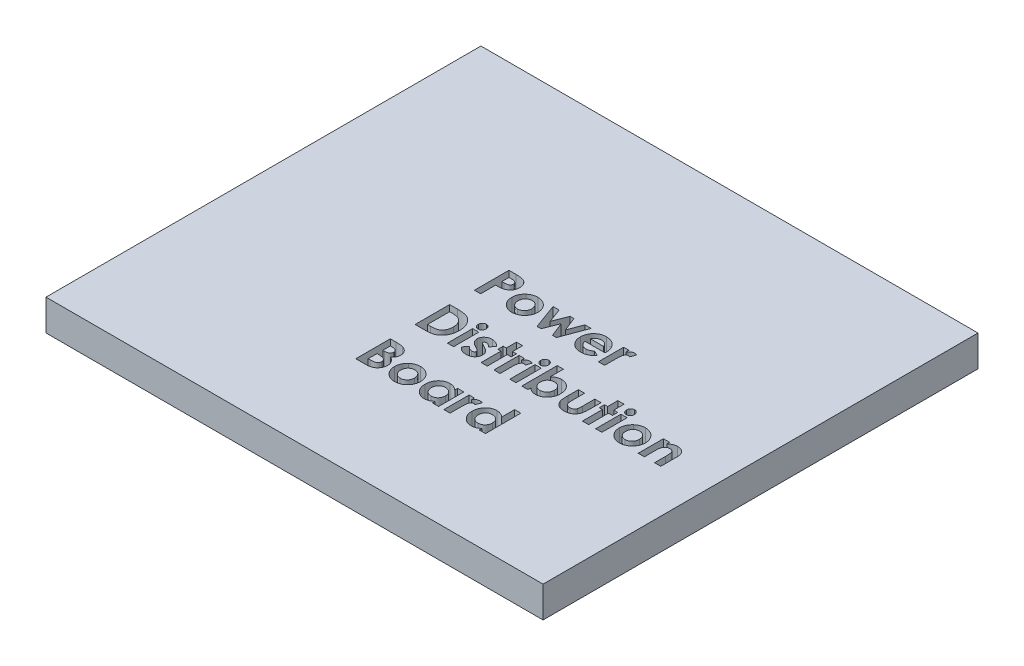
from build123d import *

# Parameters (mm, degrees)
SKETCH1_W           = 160
SKETCH1_H           = 140
BOSS_EXTRUDE1_DEPTH = 10
SKETCH2_W           = 1.994551282
SKETCH2_H           = 8.120673077
CUT_EXTRUDE1_DEPTH  = 10


with BuildPart() as part:
    # Sketch1 → Boss-Extrude1 (new body)
    with BuildSketch(Plane(origin=(0, 0, 0), x_dir=(1, 0, 0), z_dir=(0, 1, 0))):
        with Locations((80, 70)):
            Rectangle(SKETCH1_W, SKETCH1_H)
    extrude(amount=BOSS_EXTRUDE1_DEPTH)

    # Sketch2 → Cut-Extrude1 (cut)
    # profile 1 of 25: a face of its own
    with BuildSketch(Plane(origin=(0, 10, 0), x_dir=(1, 0, 0), z_dir=(0, 1, 0))):
        with BuildLine():
            Line((67.029727192, 81.991077802), (69.255788891, 81.991077802))
            add(Edge.make_bspline(
                [(69.255788891, 81.991077802), (69.401236874, 81.990426746), (69.681836522, 81.989170722), (70.086484301, 81.973939764), (70.459791689, 81.946644958), (70.80167292, 81.912912894), (71.111987421, 81.865621854), (71.3911238, 81.811406379), (71.639139982, 81.745356151), (71.85883272, 81.666955446), (72.055999855, 81.574524079), (72.242583558, 81.476078074), (72.414367015, 81.358586239), (72.580020658, 81.234711346), (72.73007378, 81.092619673), (72.873887595, 80.941767627), (73.005371194, 80.77617254), (73.125133825, 80.597838897), (73.233776986, 80.410061539), (73.328694919, 80.212504778), (73.40568703, 80.004856), (73.470273838, 79.788458457), (73.522150592, 79.563321579), (73.556681411, 79.328060755), (73.58013648, 79.084318666), (73.582206066, 78.918427646), (73.583252833, 78.834522313)],
                knots=[0, 0, 0, 0, 1.698747864, 3.27724071, 4.728299578, 6.070144658, 7.288476769, 8.393259625, 9.389771311, 10.283485332, 11.113357557, 11.931608583, 12.74405601, 13.541433047, 14.344816069, 15.154114104, 15.974336324, 16.810834471, 17.661136416, 18.50621059, 19.367396281, 20.244825668, 21.142564693, 22.063065223, 23.020325768, 24, 24, 24, 24], degree=3))
            add(Edge.make_bspline(
                [(73.583252833, 78.834522313), (73.581738292, 78.741699841), (73.578762032, 78.559292277), (73.549585095, 78.291905167), (73.499741669, 78.036975766), (73.434598919, 77.79235421), (73.343761986, 77.562065064), (73.239985055, 77.34061356), (73.112306514, 77.134208518), (72.966413369, 76.940268059), (72.80708141, 76.757215356), (72.630528105, 76.59033571), (72.440118633, 76.438491507), (72.236955209, 76.300091408), (72.020275095, 76.175414599), (71.790234637, 76.063293611), (71.545262987, 75.967314423), (71.374672101, 75.917118085), (71.288183222, 75.891668748)],
                knots=[0, 0, 0, 0, 1.102006807, 2.165578795, 3.188629044, 4.184801286, 5.166646146, 6.124351954, 7.085497154, 8.042432466, 9.003981491, 9.963833307, 10.922997304, 11.89326795, 12.880200226, 13.889073926, 14.929769137, 16, 16, 16, 16], degree=3))
            add(Edge.make_bspline(
                [(71.288183222, 75.891668748), (71.23121667, 75.877495378), (71.107808776, 75.846791294), (70.903602606, 75.815618942), (70.668276436, 75.786957881), (70.401069302, 75.762327169), (70.101827153, 75.745584024), (69.770839734, 75.732508373), (69.407957046, 75.723001024), (69.155622775, 75.722663662), (69.024278474, 75.722488059)],
                knots=[0, 0, 0, 0, 0.618981996, 1.340914327, 2.176866532, 3.120127938, 4.170906482, 5.338178032, 6.614476169, 8, 8, 8, 8], degree=3))
            Line((69.024278474, 75.722488059), (69.024278474, 70.878577802))
            Line((69.024278474, 70.878577802), (67.029727192, 70.878577802))
            Line((67.029727192, 70.878577802), (67.029727192, 81.991077802))
        make_face()
        with BuildLine():
            Line((69.024278474, 77.717039341), (69.729940032, 77.717039341))
            add(Edge.make_bspline(
                [(69.729940032, 77.717039341), (69.858346294, 77.717853536), (70.094615722, 77.719351668), (70.417276327, 77.741015521), (70.676572596, 77.774100601), (70.881421463, 77.821552256), (71.043169047, 77.893566427), (71.182666211, 77.976873262), (71.30231649, 78.082212468), (71.405916021, 78.202580534), (71.488740724, 78.340889475), (71.546175341, 78.494887199), (71.583483739, 78.661338047), (71.586929516, 78.777176821), (71.588701551, 78.836748375)],
                knots=[0, 0, 0, 0, 1.8619151, 3.425951444, 4.686033666, 5.651700536, 6.461346321, 7.243864085, 7.999046032, 8.762387399, 9.539336099, 10.322741239, 11.137448474, 12, 12, 12, 12], degree=3))
            add(Edge.make_bspline(
                [(71.588701551, 78.836748375), (71.586947744, 78.888795266), (71.583544938, 78.989778748), (71.558546994, 79.135522961), (71.518707463, 79.271386633), (71.460981514, 79.395950848), (71.38635553, 79.509003952), (71.295371355, 79.610501409), (71.189196493, 79.702616872), (71.107223292, 79.751374994), (71.065577052, 79.776146412)],
                knots=[0, 0, 0, 0, 1.102301479, 2.1387299, 3.123554645, 4.094223062, 5.036071848, 5.982632524, 6.975082478, 8, 8, 8, 8], degree=3))
            add(Edge.make_bspline(
                [(71.065577052, 79.776146412), (71.030300282, 79.793986886), (70.955612133, 79.831758825), (70.828410973, 79.875671466), (70.681622777, 79.912716615), (70.514256558, 79.943463732), (70.32697999, 79.967326688), (70.119826485, 79.98557588), (69.892491197, 79.99291459), (69.734393107, 79.995289336), (69.652027873, 79.99652652)],
                knots=[0, 0, 0, 0, 0.656809284, 1.390599849, 2.23162475, 3.173112763, 4.218524733, 5.370385145, 6.63003504, 8, 8, 8, 8], degree=3))
            Line((69.652027873, 79.99652652), (69.024278474, 79.99652652))
            Line((69.024278474, 79.99652652), (69.024278474, 77.717039341))
        make_face(mode=Mode.SUBTRACT)
    # profile 2 of 25: a face of its own
    with BuildSketch(Plane(origin=(0, 10, 0), x_dir=(1, 0, 0), z_dir=(0, 1, 0))):
        with BuildLine():
            add(Edge.make_bspline(
                [(79.16176345, 79.141718828), (79.256061984, 79.140040721), (79.44281581, 79.136717309), (79.720962304, 79.109052938), (79.994246156, 79.063917376), (80.264238165, 79.005474701), (80.528431204, 78.923587774), (80.788210931, 78.825377066), (81.045900109, 78.712619688), (81.295102943, 78.578398968), (81.537619738, 78.432824357), (81.767540093, 78.272243616), (81.982954677, 78.097918053), (82.187862319, 77.913889543), (82.372713992, 77.712146085), (82.549322709, 77.502408525), (82.708146732, 77.277162699), (82.855194899, 77.041897325), (82.986110824, 76.797972898), (83.099787229, 76.547086243), (83.19844766, 76.292706046), (83.2756968, 76.031733781), (83.339651968, 75.767610714), (83.380012225, 75.497100215), (83.408705569, 75.222981106), (83.411923002, 75.038421565), (83.413541295, 74.945592526)],
                knots=[0, 0, 0, 0, 1.022364134, 2.024744242, 3.027414945, 4.024939316, 5.017584196, 6.023349371, 7.035562955, 8.064994934, 9.090267829, 10.101425541, 11.102933353, 12.093946398, 13.084502048, 14.067315274, 15.065326281, 16.070028806, 17.074376865, 18.064572984, 19.055292013, 20.030201733, 21.013838017, 21.999348303, 22.993720005, 24, 24, 24, 24], degree=3))
            add(Edge.make_bspline(
                [(83.413541295, 74.945592526), (83.411833455, 74.85203826), (83.408437884, 74.666031171), (83.381050315, 74.389333633), (83.335741989, 74.11755105), (83.277075009, 73.849082303), (83.195494525, 73.587362706), (83.100176438, 73.32853441), (82.983169736, 73.076125341), (82.853810205, 72.827381954), (82.70581658, 72.589624008), (82.547130037, 72.362121762), (82.371261044, 72.150843668), (82.18788916, 71.949237406), (81.988316642, 71.764120396), (81.77572904, 71.592486833), (81.551966773, 71.432238418), (81.315420752, 71.287134882), (81.069120738, 71.15963758), (80.817220535, 71.044688357), (80.558247171, 70.948984922), (80.292736603, 70.870941405), (80.02052781, 70.810514264), (79.742221758, 70.769465388), (79.458417815, 70.740916369), (79.267201893, 70.73772234), (79.170667697, 70.736109853)],
                knots=[0, 0, 0, 0, 1.012026251, 2.012137606, 3.004615893, 3.992048833, 4.982446996, 5.968083444, 6.973977695, 7.990229942, 8.999482246, 10.001782172, 10.988562221, 11.971415814, 12.948383116, 13.930088534, 14.925840678, 15.924049238, 16.929462851, 17.924729459, 18.917889337, 19.913673841, 20.916777188, 21.931792057, 22.95587778, 24, 24, 24, 24], degree=3))
            add(Edge.make_bspline(
                [(79.170667697, 70.736109853), (79.029515017, 70.740252963), (78.751300935, 70.748419095), (78.341557369, 70.804354962), (77.947929061, 70.900635255), (77.569774598, 71.03484786), (77.206602748, 71.206836312), (76.861582985, 71.419698139), (76.531283302, 71.669242702), (76.22142474, 71.953360828), (75.93755232, 72.26506414), (75.689555607, 72.597805526), (75.47898633, 72.946597752), (75.306033935, 73.31183856), (75.172549954, 73.694028791), (75.076151745, 74.092025833), (75.02014749, 74.506948396), (75.012050424, 74.788858754), (75.00793232, 74.932236156)],
                knots=[0, 0, 0, 0, 1.029999031, 2.030143771, 3.011211297, 3.982305373, 4.953580601, 5.938004764, 6.935448627, 7.970290061, 9.001484052, 10.007591832, 10.993831261, 11.969999897, 12.951306496, 13.942897864, 14.953773953, 16, 16, 16, 16], degree=3))
            add(Edge.make_bspline(
                [(75.00793232, 74.932236156), (75.012194035, 75.085331791), (75.02057035, 75.386238196), (75.08708198, 75.827072938), (75.193293878, 76.24915131), (75.345754368, 76.651292628), (75.540509234, 77.034238585), (75.778260788, 77.397181506), (76.060184012, 77.740203603), (76.276080749, 77.947675126), (76.385864512, 78.053174657)],
                knots=[0, 0, 0, 0, 1.043912699, 2.05178951, 3.033892, 4.007821512, 4.978932272, 5.95884105, 6.962068106, 8, 8, 8, 8], degree=3))
            add(Edge.make_bspline(
                [(76.385864512, 78.053174657), (76.486602087, 78.140621901), (76.685336471, 78.313137212), (77.008214435, 78.5319446), (77.338805036, 78.720927429), (77.681070545, 78.876306464), (78.03596511, 78.993459749), (78.401670098, 79.078736859), (78.778109465, 79.131116558), (79.033228894, 79.138166778), (79.16176345, 79.141718828)],
                knots=[0, 0, 0, 0, 1.048115528, 2.067714963, 3.060638214, 4.039924844, 5.017819947, 5.994373833, 6.98952318, 8, 8, 8, 8], degree=3))
        make_face()
        with BuildLine():
            add(Edge.make_bspline(
                [(79.206284684, 77.289635494), (79.129061132, 77.287068839), (78.977045738, 77.282016351), (78.753275085, 77.254900996), (78.541630444, 77.199325748), (78.337908159, 77.128649243), (78.145712098, 77.034129375), (77.959778694, 76.923519348), (77.789776075, 76.785104509), (77.627477272, 76.633273558), (77.480146135, 76.46466936), (77.354606016, 76.280975214), (77.242433139, 76.089218871), (77.157378134, 75.882379893), (77.086986987, 75.666111789), (77.039347102, 75.436920326), (77.006193069, 75.197365695), (77.003731852, 75.033269131), (77.002483602, 74.950044649)],
                knots=[0, 0, 0, 0, 1.030650113, 2.02884584, 2.99876339, 3.944280128, 4.900564847, 5.851248946, 6.823638398, 7.81794922, 8.81432732, 9.802856497, 10.78262424, 11.771747962, 12.779760563, 13.812642396, 14.89064281, 16, 16, 16, 16], degree=3))
            add(Edge.make_bspline(
                [(77.002483602, 74.950044649), (77.003944224, 74.863885253), (77.00679873, 74.69550326), (77.036357732, 74.449642906), (77.085101501, 74.216323061), (77.154351121, 73.995904151), (77.241444211, 73.786804039), (77.348297333, 73.590195916), (77.476038202, 73.407261911), (77.620865342, 73.238227294), (77.779444875, 73.084792701), (77.95320393, 72.953120876), (78.134866132, 72.838715535), (78.328617964, 72.746830388), (78.531707594, 72.6758876), (78.744737913, 72.623654811), (78.968828393, 72.595514317), (79.121622687, 72.59066712), (79.199606499, 72.588193187)],
                knots=[0, 0, 0, 0, 1.141730614, 2.231293227, 3.276944405, 4.297399982, 5.28939179, 6.275415646, 7.257752684, 8.24146775, 9.222424823, 10.176631434, 11.126518621, 12.063689483, 13.012557477, 13.974037417, 14.965980454, 16, 16, 16, 16], degree=3))
            add(Edge.make_bspline(
                [(79.199606499, 72.588193187), (79.277629315, 72.590387454), (79.430599327, 72.594689491), (79.65495296, 72.626904955), (79.869071168, 72.677605745), (80.073895342, 72.749159114), (80.267769462, 72.843011013), (80.451435693, 72.957963684), (80.626509771, 73.091466946), (80.787217457, 73.247796558), (80.935981488, 73.417358333), (81.066438646, 73.601258034), (81.175453567, 73.797866207), (81.264865323, 74.005945793), (81.334250696, 74.225210787), (81.382187502, 74.45647617), (81.415359261, 74.699025234), (81.417764815, 74.865338145), (81.418990012, 74.950044649)],
                knots=[0, 0, 0, 0, 1.031504075, 2.022346795, 2.991027682, 3.937587355, 4.885570121, 5.833146507, 6.798790848, 7.791235734, 8.792807298, 9.778388351, 10.766749885, 11.760164525, 12.768777521, 13.802286646, 14.880660483, 16, 16, 16, 16], degree=3))
            add(Edge.make_bspline(
                [(81.418990012, 74.950044649), (81.417510809, 75.034721548), (81.414608133, 75.200885091), (81.385047024, 75.443762199), (81.336781613, 75.674280067), (81.266638825, 75.891454405), (81.180063404, 76.097762827), (81.073136426, 76.292149317), (80.94476558, 76.473656472), (80.799234395, 76.64138428), (80.638277655, 76.792665836), (80.467535476, 76.927572259), (80.283103509, 77.039150236), (80.088441809, 77.131130319), (79.883032473, 77.201895863), (79.667106108, 77.254424669), (79.440000966, 77.282164736), (79.285004317, 77.287119216), (79.206284684, 77.289635494)],
                knots=[0, 0, 0, 0, 1.123894411, 2.205445421, 3.243160173, 4.246488011, 5.231014757, 6.210004299, 7.185865357, 8.177612767, 9.153374344, 10.115157457, 11.061423229, 12.009021698, 12.96873347, 13.94135618, 14.954456845, 16, 16, 16, 16], degree=3))
        make_face(mode=Mode.SUBTRACT)
    # profile 3 of 25: a face of its own
    with BuildSketch(Plane(origin=(0, 10, 0), x_dir=(1, 0, 0), z_dir=(0, 1, 0))):
        Polygon((84.197115012, 78.999250879), (86.187214171, 78.999250879), (87.901281679, 74.380172854), (89.715521964, 78.999250879), (90.937629836, 78.999250879), (92.745191936, 74.431372273), (94.452581258, 78.999250879), (96.449358602, 78.999250879), (93.413010445, 70.878577802), (92.155285585, 70.878577802), (90.323236807, 75.506560074), (88.504544399, 70.878577802), (87.208976491, 70.878577802), align=None)
    # profile 4 of 25: a face of its own
    with BuildSketch(Plane(origin=(0, 10, 0), x_dir=(1, 0, 0), z_dir=(0, 1, 0))):
        with BuildLine():
            Line((105.489395161, 74.44027652), (99.085015653, 74.44027652))
            add(Edge.make_bspline(
                [(99.085015653, 74.44027652), (99.098073666, 74.365861264), (99.123733691, 74.219629413), (99.179455348, 74.007214962), (99.250564539, 73.807039169), (99.335784426, 73.618834447), (99.433678203, 73.441605832), (99.547863184, 73.276184596), (99.676891036, 73.12271685), (99.820015754, 72.98186958), (99.97485171, 72.855667374), (100.140648006, 72.745106264), (100.317575733, 72.654452917), (100.503606482, 72.578041552), (100.70013033, 72.51751601), (100.907436512, 72.475772695), (101.12497549, 72.451114765), (101.273169687, 72.447548278), (101.348920401, 72.445725238)],
                knots=[0, 0, 0, 0, 1.091296461, 2.144483647, 3.168565212, 4.157007626, 5.126487748, 6.090021542, 7.05641414, 8.019231907, 8.98705074, 9.938580405, 10.892824166, 11.854447369, 12.841318655, 13.858982407, 14.905600794, 16, 16, 16, 16], degree=3))
            add(Edge.make_bspline(
                [(101.348920401, 72.445725238), (101.440356655, 72.448139244), (101.620421568, 72.452893131), (101.884218005, 72.495053054), (102.139347586, 72.558733764), (102.383395887, 72.653432325), (102.619189823, 72.771315386), (102.842847503, 72.918183176), (103.058240265, 73.089743737), (103.189655233, 73.221982552), (103.256655277, 73.289402622)],
                knots=[0, 0, 0, 0, 1.021034703, 2.010718019, 2.977989445, 3.954245119, 4.929443971, 5.918328161, 6.938689359, 8, 8, 8, 8], degree=3))
            Line((103.256655277, 73.289402622), (104.926201551, 72.494698595))
            add(Edge.make_bspline(
                [(104.926201551, 72.494698595), (104.873636861, 72.422062261), (104.769481861, 72.278136036), (104.599452318, 72.075594666), (104.422015663, 71.886615351), (104.237039565, 71.712441037), (104.044289427, 71.553568051), (103.844301433, 71.408061034), (103.634152841, 71.279826791), (103.418045534, 71.162661427), (103.191512173, 71.062216103), (102.955179678, 70.976559877), (102.710049048, 70.899127377), (102.453024813, 70.840128054), (102.186247211, 70.793424671), (101.90907806, 70.760259082), (101.621553887, 70.739774287), (101.426125382, 70.73734584), (101.326659784, 70.736109853)],
                knots=[0, 0, 0, 0, 1.028154879, 2.037251081, 3.030720504, 4.000128189, 4.949298328, 5.894184978, 6.834267904, 7.770992897, 8.712077017, 9.673380525, 10.653304757, 11.658697181, 12.695551717, 13.758623199, 14.859225354, 16, 16, 16, 16], degree=3))
            add(Edge.make_bspline(
                [(101.326659784, 70.736109853), (101.173633595, 70.739229597), (100.873940623, 70.745339435), (100.435585476, 70.802047476), (100.019269669, 70.896075522), (99.62381767, 71.023892207), (99.250938887, 71.192650275), (98.900448782, 71.399055391), (98.568845457, 71.639150355), (98.266261245, 71.917974123), (97.9905981, 72.221457217), (97.748472734, 72.547377338), (97.545865674, 72.893457402), (97.379480683, 73.257406981), (97.250160487, 73.640157642), (97.156928128, 74.04187641), (97.099775574, 74.462371417), (97.093602814, 74.748775456), (97.090464371, 74.894393107)],
                knots=[0, 0, 0, 0, 1.103565453, 2.161269334, 3.182010356, 4.179077853, 5.15417608, 6.128274628, 7.109042802, 8.101804412, 9.090965879, 10.063106201, 11.02526161, 11.978650795, 12.945248442, 13.93468508, 14.949922959, 16, 16, 16, 16], degree=3))
            add(Edge.make_bspline(
                [(97.090464371, 74.894393107), (97.093633703, 75.043711088), (97.099869221, 75.337487511), (97.156436044, 75.767691941), (97.250418243, 76.178165154), (97.380116728, 76.569472416), (97.543977639, 76.942837568), (97.749162525, 77.294994112), (97.990477946, 77.627168067), (98.26514802, 77.937805488), (98.569014072, 78.218189699), (98.891900462, 78.468068063), (99.237435147, 78.676283302), (99.601709834, 78.844521086), (99.982394491, 78.981210039), (100.383889298, 79.072165121), (100.803139495, 79.133236015), (101.089729697, 79.138860263), (101.235391254, 79.141718828)],
                knots=[0, 0, 0, 0, 1.079208495, 2.12329425, 3.130605359, 4.119693003, 5.099659317, 6.073216462, 7.060498243, 8.06384408, 9.066070512, 10.045757761, 11.010926815, 11.975797609, 12.942977511, 13.929384301, 14.947594487, 16, 16, 16, 16], degree=3))
            add(Edge.make_bspline(
                [(101.235391254, 79.141718828), (101.389150543, 79.138550684), (101.69104106, 79.132330359), (102.132449215, 79.076082774), (102.55152931, 78.981481357), (102.950066858, 78.854769879), (103.322972374, 78.681748805), (103.678439721, 78.480422992), (104.007942776, 78.235138193), (104.314993691, 77.957678899), (104.592169896, 77.649847428), (104.83445261, 77.315448168), (105.04060538, 76.957744661), (105.207694246, 76.575286341), (105.336881653, 76.169221386), (105.430200317, 75.740077152), (105.486916932, 75.286221379), (105.492974831, 74.97544032), (105.496073346, 74.816480947)],
                knots=[0, 0, 0, 0, 1.080001299, 2.120471247, 3.119684163, 4.095710327, 5.052285597, 6.002875087, 6.961153713, 7.931888285, 8.906493152, 9.865905668, 10.82813294, 11.801621613, 12.7925306, 13.817193356, 14.883530496, 16, 16, 16, 16], degree=3))
            Line((105.496073346, 74.816480947), (105.489395161, 74.44027652))
        make_face()
        with BuildLine():
            add(Edge.make_bspline(
                [(103.501522064, 76.007423956), (103.463883661, 76.108994758), (103.389048712, 76.310943972), (103.219999676, 76.58958461), (102.995677015, 76.83089872), (102.734773666, 77.044536015), (102.436675254, 77.217937388), (102.110775381, 77.343485614), (101.76119336, 77.418765905), (101.520699766, 77.427594961), (101.397893758, 77.432103443)],
                knots=[0, 0, 0, 0, 0.954238005, 1.897273737, 2.851915805, 3.847685534, 4.862635127, 5.880135777, 6.917509367, 8, 8, 8, 8], degree=3))
            add(Edge.make_bspline(
                [(101.397893758, 77.432103443), (101.263769603, 77.427772497), (101.001584808, 77.419306399), (100.623401091, 77.329266343), (100.266669854, 77.194884247), (100.056361335, 77.056333453), (99.950953654, 76.986891103)],
                knots=[0, 0, 0, 0, 1.044195649, 2.041185066, 3.018232172, 4, 4, 4, 4], degree=3))
            add(Edge.make_bspline(
                [(99.950953654, 76.986891103), (99.885187134, 76.934002289), (99.744976276, 76.82124604), (99.56288403, 76.596308027), (99.383521653, 76.32395859), (99.281544252, 76.117089951), (99.227483602, 76.007423956)],
                knots=[0, 0, 0, 0, 0.82159062, 1.751589201, 2.808063854, 4, 4, 4, 4], degree=3))
            Line((99.227483602, 76.007423956), (103.501522064, 76.007423956))
        make_face(mode=Mode.SUBTRACT)
    # profile 5 of 25: a face of its own
    with BuildSketch(Plane(origin=(0, 10, 0), x_dir=(1, 0, 0), z_dir=(0, 1, 0))):
        with BuildLine():
            Line((106.920752833, 78.999250879), (108.630368218, 78.999250879))
            Line((108.630368218, 78.999250879), (108.630368218, 77.999749176))
            add(Edge.make_bspline(
                [(108.630368218, 77.999749176), (108.678729955, 78.088575168), (108.773254977, 78.262189253), (108.946905369, 78.495231781), (109.146401973, 78.691493696), (109.36457626, 78.855079995), (109.602089471, 78.982579452), (109.852581427, 79.073438889), (110.113909174, 79.132484932), (110.292178103, 79.1386187), (110.382278774, 79.141718828)],
                knots=[0, 0, 0, 0, 1.09866127, 2.147379032, 3.14564304, 4.131443017, 5.102343063, 6.064490016, 7.021754664, 8, 8, 8, 8], degree=3))
            add(Edge.make_bspline(
                [(110.382278774, 79.141718828), (110.447703105, 79.138655253), (110.580930402, 79.132416722), (110.783987552, 79.096152043), (110.989974459, 79.030578608), (111.125531594, 78.971538445), (111.194791295, 78.941373275)],
                knots=[0, 0, 0, 0, 0.931404136, 1.896671404, 2.925354185, 4, 4, 4, 4], degree=3))
            Line((111.194791295, 78.941373275), (110.575946142, 77.251792446))
            add(Edge.make_bspline(
                [(110.575946142, 77.251792446), (110.520630223, 77.278518423), (110.416657588, 77.328752973), (110.265707376, 77.388034918), (110.128713799, 77.424205863), (110.041862386, 77.429602885), (110.001622224, 77.432103443)],
                knots=[0, 0, 0, 0, 1.214386998, 2.282580073, 3.20428172, 4, 4, 4, 4], degree=3))
            add(Edge.make_bspline(
                [(110.001622224, 77.432103443), (109.963627685, 77.430446441), (109.888885881, 77.427186832), (109.778569069, 77.399253092), (109.674673605, 77.351082222), (109.572192771, 77.289370558), (109.479211169, 77.203586728), (109.386286999, 77.104276714), (109.304397246, 76.981665293), (109.217979807, 76.845192554), (109.144398448, 76.678150045), (109.081304697, 76.478735712), (109.02508766, 76.244642194), (108.986402663, 75.974626571), (108.94901206, 75.671301708), (108.926756255, 75.332441239), (108.910168722, 74.959116674), (108.909154505, 74.698522654), (108.90862593, 74.562709914)],
                knots=[0, 0, 0, 0, 0.544232178, 1.070598461, 1.618251235, 2.182094276, 2.777567932, 3.425210017, 4.127676488, 4.886675562, 5.738955394, 6.734782583, 7.883056018, 9.186093582, 10.642914445, 12.264202625, 14.053029461, 16, 16, 16, 16], degree=3))
            Line((108.90862593, 74.562709914), (108.915304115, 74.166470931))
            Line((108.915304115, 74.166470931), (108.915304115, 70.878577802))
            Line((108.915304115, 70.878577802), (106.920752833, 70.878577802))
            Line((106.920752833, 70.878577802), (106.920752833, 78.999250879))
        make_face()
    # profile 6 of 25: a face of its own
    with BuildSketch(Plane(origin=(0, 10, 0), x_dir=(1, 0, 0), z_dir=(0, 1, 0))):
        with BuildLine():
            Line((67.029727192, 62.897648315), (69.54295085, 62.897648315))
            add(Edge.make_bspline(
                [(69.54295085, 62.897648315), (69.738885541, 62.896278664), (70.117629515, 62.893631115), (70.666354604, 62.863799593), (71.176599111, 62.817920831), (71.648691948, 62.754806279), (72.08166525, 62.671288443), (72.474960706, 62.566531687), (72.829898309, 62.445607441), (73.150369878, 62.303315526), (73.442929596, 62.137417286), (73.720724386, 61.952619964), (73.983208804, 61.742153897), (74.234066402, 61.510079392), (74.470059812, 61.25215072), (74.695119168, 60.972640112), (74.903733997, 60.66749428), (75.102210273, 60.344029658), (75.281705655, 60.000875435), (75.438268233, 59.640952467), (75.569421655, 59.266576992), (75.675990602, 58.877350025), (75.760938351, 58.474563679), (75.82037458, 58.057405171), (75.857118648, 57.626260718), (75.860846027, 57.334052953), (75.862740012, 57.185573996)],
                knots=[0, 0, 0, 0, 1.44355588, 2.790409838, 4.047694926, 5.217575253, 6.298404546, 7.294384826, 8.214239204, 9.058592145, 9.873746385, 10.689560431, 11.514393297, 12.350027578, 13.205127629, 14.088021785, 14.991911688, 15.926770944, 16.882954281, 17.842803888, 18.816321264, 19.80318086, 20.814351908, 21.847355356, 22.906180909, 24, 24, 24, 24], degree=3))
            add(Edge.make_bspline(
                [(75.862740012, 57.185573996), (75.857780536, 56.976060523), (75.848017516, 56.563620987), (75.76577929, 55.95837072), (75.632772232, 55.378177971), (75.445752228, 54.827581236), (75.213897488, 54.311483657), (74.936921037, 53.838986399), (74.618883997, 53.412625589), (74.263491517, 53.034524154), (73.878688016, 52.709540846), (73.478799583, 52.431216426), (73.059930575, 52.211734395), (72.690848441, 52.072549967), (72.370808185, 51.985989294), (72.089816302, 51.934831103), (71.770638194, 51.887915956), (71.410297802, 51.85166094), (71.010375861, 51.819330375), (70.569278277, 51.801763205), (70.088433198, 51.787167494), (69.754440827, 51.78583901), (69.580793899, 51.785148315)],
                knots=[0, 0, 0, 0, 1.315458931, 2.589557908, 3.828601765, 5.048913369, 6.235739168, 7.376350998, 8.481830359, 9.569842114, 10.627874879, 11.640079404, 12.624025415, 13.590060155, 14.111227486, 14.704434459, 15.382649715, 16.137166398, 16.978595427, 17.902333227, 18.909396075, 20, 20, 20, 20], degree=3))
            Line((69.580793899, 51.785148315), (67.029727192, 51.785148315))
            Line((67.029727192, 51.785148315), (67.029727192, 62.897648315))
        make_face()
        with BuildLine():
            Line((69.024278474, 60.903097033), (69.024278474, 53.779699597))
            Line((69.024278474, 53.779699597), (70.066075349, 53.779699597))
            add(Edge.make_bspline(
                [(70.066075349, 53.779699597), (70.190033178, 53.779926739), (70.428445348, 53.780363609), (70.772658554, 53.801172095), (71.090968492, 53.822058076), (71.38249893, 53.861700367), (71.649371533, 53.90585909), (71.887920173, 53.967312), (72.103062373, 54.031863075), (72.292170212, 54.114044595), (72.465377585, 54.206545365), (72.625747827, 54.314920741), (72.780550011, 54.435267508), (72.926889986, 54.571125237), (73.065321611, 54.720694916), (73.19502584, 54.884747211), (73.317733879, 55.062781593), (73.430296045, 55.255739375), (73.533155956, 55.461582879), (73.624404223, 55.67831821), (73.700062501, 55.907750307), (73.762945029, 56.147731409), (73.807881726, 56.400350825), (73.845058271, 56.663737437), (73.864223864, 56.938934761), (73.866854222, 57.126188218), (73.86818873, 57.221190983)],
                knots=[0, 0, 0, 0, 1.50275155, 2.890291501, 4.180787663, 5.369391935, 6.45668281, 7.458360028, 8.354766181, 9.177074746, 9.954075863, 10.732690366, 11.5210699, 12.329727389, 13.151100085, 13.990027547, 14.863562427, 15.770965086, 16.696477834, 17.652329173, 18.619756807, 19.62365428, 20.657822005, 21.729286259, 22.847956731, 24, 24, 24, 24], degree=3))
            add(Edge.make_bspline(
                [(73.86818873, 57.221190983), (73.865530843, 57.36677374), (73.860348168, 57.650648835), (73.810367575, 58.064119108), (73.729008704, 58.453463311), (73.612917433, 58.817236482), (73.466580789, 59.156461016), (73.283406366, 59.468262962), (73.071277287, 59.757880163), (72.903531398, 59.927778906), (72.81971367, 60.012672353)],
                knots=[0, 0, 0, 0, 1.13821349, 2.219428113, 3.251817212, 4.244760574, 5.201143372, 6.134805572, 7.068016741, 8, 8, 8, 8], degree=3))
            add(Edge.make_bspline(
                [(72.81971367, 60.012672353), (72.737061454, 60.085013047), (72.568253661, 60.232760722), (72.271882649, 60.40980022), (71.945297143, 60.565346773), (71.581025846, 60.688677842), (71.182589279, 60.786213309), (70.747614344, 60.853481136), (70.278430428, 60.896706729), (69.953390742, 60.900921296), (69.785591575, 60.903097033)],
                knots=[0, 0, 0, 0, 0.813307809, 1.661089106, 2.549956539, 3.493439533, 4.508053171, 5.589449661, 6.755572447, 8, 8, 8, 8], degree=3))
            Line((69.785591575, 60.903097033), (69.024278474, 60.903097033))
        make_face(mode=Mode.SUBTRACT)
    # profile 7 of 25: a face of its own
    with BuildSketch(Plane(origin=(0, 10, 0), x_dir=(1, 0, 0), z_dir=(0, 1, 0))):
        with BuildLine():
            add(Edge.make_bspline(
                [(78.422710966, 63.325052161), (78.508676112, 63.320834386), (78.677476959, 63.312552377), (78.919307143, 63.231821218), (79.141258241, 63.105116077), (79.337469167, 62.931273602), (79.500659068, 62.723673891), (79.625342212, 62.491252213), (79.694797999, 62.233736478), (79.70444438, 62.055847302), (79.709374628, 61.964928463)],
                knots=[0, 0, 0, 0, 0.989868614, 1.943702388, 2.910836514, 3.924849579, 4.949916355, 5.946401046, 6.950409252, 8, 8, 8, 8], degree=3))
            add(Edge.make_bspline(
                [(79.709374628, 61.964928463), (79.704620776, 61.874679646), (79.695357668, 61.698825527), (79.623743645, 61.444805689), (79.504064848, 61.212496898), (79.339553211, 61.007980428), (79.145469468, 60.836937789), (78.928368172, 60.707932392), (78.688855422, 60.631692289), (78.522673855, 60.622717951), (78.438293398, 60.618161136)],
                knots=[0, 0, 0, 0, 1.05296456, 2.051751585, 3.055639087, 4.085634717, 5.099016424, 6.062201612, 7.016062274, 8, 8, 8, 8], degree=3))
            add(Edge.make_bspline(
                [(78.438293398, 60.618161136), (78.351577847, 60.622363833), (78.18130844, 60.630615996), (77.93749475, 60.711536047), (77.712583392, 60.837243304), (77.517223628, 61.014637649), (77.352164838, 61.223712513), (77.232927902, 61.46154517), (77.158342249, 61.720821791), (77.149488998, 61.901345626), (77.144951551, 61.993867265)],
                knots=[0, 0, 0, 0, 0.989065327, 1.942068821, 2.907541208, 3.917690034, 4.939857478, 5.938239964, 6.943311734, 8, 8, 8, 8], degree=3))
            add(Edge.make_bspline(
                [(77.144951551, 61.993867265), (77.149889534, 62.082583604), (77.159589488, 62.256854044), (77.229461322, 62.508644449), (77.351285487, 62.737158756), (77.513299914, 62.94095816), (77.707787448, 63.111557818), (77.929605305, 63.234414841), (78.169807964, 63.311811574), (78.337539518, 63.32059306), (78.422710966, 63.325052161)],
                knots=[0, 0, 0, 0, 1.038616768, 2.040212704, 3.031499824, 4.052181184, 5.074969369, 6.039807101, 7.004644834, 8, 8, 8, 8], degree=3))
        make_face()
    # profile 8 of 25: a face of its own
    with BuildSketch(Plane(origin=(0, 10, 0), x_dir=(1, 0, 0), z_dir=(0, 1, 0))):
        with Locations((78.427163089, 55.845484854)):
            Rectangle(SKETCH2_W, SKETCH2_H)
    # profile 9 of 25: a face of its own
    with BuildSketch(Plane(origin=(0, 10, 0), x_dir=(1, 0, 0), z_dir=(0, 1, 0))):
        with BuildLine():
            Line((86.262900269, 58.652548656), (85.043018458, 57.341398315))
            add(Edge.make_bspline(
                [(85.043018458, 57.341398315), (84.982103915, 57.408803559), (84.865597469, 57.537724258), (84.687237361, 57.713471984), (84.511533383, 57.859817923), (84.341759764, 57.982754612), (84.174449122, 58.077032356), (84.010992184, 58.144863081), (83.851310523, 58.187923034), (83.745466768, 58.193496983), (83.694025069, 58.196206007)],
                knots=[0, 0, 0, 0, 1.327646587, 2.539285, 3.655602211, 4.666613517, 5.598770349, 6.454635452, 7.248928967, 8, 8, 8, 8], degree=3))
            add(Edge.make_bspline(
                [(83.694025069, 58.196206007), (83.641971236, 58.194619585), (83.542304339, 58.191582079), (83.401652014, 58.1655279), (83.278079538, 58.120423313), (83.173515336, 58.058941558), (83.089506606, 57.983202351), (83.030688177, 57.896558484), (82.99119106, 57.801704786), (82.98784986, 57.73432654), (82.986137448, 57.699794248)],
                knots=[0, 0, 0, 0, 1.295068245, 2.479652818, 3.543291146, 4.55379989, 5.481948265, 6.332409746, 7.145336708, 8, 8, 8, 8], degree=3))
            add(Edge.make_bspline(
                [(82.986137448, 57.699794248), (82.991939257, 57.647462901), (83.003977335, 57.538881434), (83.086662237, 57.412943132), (83.196060334, 57.320041025), (83.322164707, 57.23359028), (83.492942674, 57.136929091), (83.622499175, 57.07074235), (83.694025069, 57.034201801)],
                knots=[0, 0, 0, 0, 0.916701701, 1.902049539, 2.5493345, 3.440293453, 4.586830489, 6, 6, 6, 6], degree=3))
            Line((83.694025069, 57.034201801), (84.415269059, 56.669127682))
            add(Edge.make_bspline(
                [(84.415269059, 56.669127682), (84.507025085, 56.622536953), (84.685049011, 56.532142186), (84.935333974, 56.386278091), (85.166501156, 56.244896135), (85.373913411, 56.099998727), (85.558840235, 55.954103219), (85.719968103, 55.805766897), (85.861205175, 55.659692304), (86.018704337, 55.463846209), (86.176250768, 55.202995146), (86.307595561, 54.863770494), (86.391352538, 54.500535478), (86.400619283, 54.249126673), (86.405368218, 54.120287037)],
                knots=[0, 0, 0, 0, 1.076693506, 2.088987655, 3.030641824, 3.911722491, 4.735175175, 5.493635918, 6.202154166, 6.859459289, 8.120623445, 9.372284821, 10.653373066, 12, 12, 12, 12], degree=3))
            add(Edge.make_bspline(
                [(86.405368218, 54.120287037), (86.402506954, 54.03336634), (86.396906702, 53.863239468), (86.361503088, 53.612828932), (86.297909029, 53.374725589), (86.214219345, 53.145217881), (86.101491847, 52.928456009), (85.964635142, 52.723389185), (85.805810247, 52.527324995), (85.620818398, 52.346970408), (85.41816292, 52.178881908), (85.192877158, 52.037507409), (84.954922267, 51.913206731), (84.698011857, 51.816138969), (84.425750699, 51.737442804), (84.135804954, 51.682908333), (83.829158467, 51.648588394), (83.619176219, 51.644683149), (83.511488009, 51.642680366)],
                knots=[0, 0, 0, 0, 0.976600749, 1.911466839, 2.833459288, 3.740827163, 4.650527853, 5.570709661, 6.506801416, 7.479409329, 8.468875524, 9.458587492, 10.461481786, 11.480119772, 12.538142914, 13.641687514, 14.790552763, 16, 16, 16, 16], degree=3))
            add(Edge.make_bspline(
                [(83.511488009, 51.642680366), (83.36881038, 51.647223856), (83.088746756, 51.656142326), (82.679734108, 51.718267117), (82.293517584, 51.825806177), (81.929779433, 51.976454643), (81.586291812, 52.168422087), (81.267960107, 52.406611663), (80.96926575, 52.684817528), (80.79548227, 52.898188469), (80.706650269, 53.007256188)],
                knots=[0, 0, 0, 0, 1.056901255, 2.07460411, 3.05625841, 4.019970729, 4.984811261, 5.963335951, 6.958928997, 8, 8, 8, 8], degree=3))
            Line((80.706650269, 53.007256188), (81.915401771, 54.349571392))
            add(Edge.make_bspline(
                [(81.915401771, 54.349571392), (81.974296226, 54.287452887), (82.091220981, 54.164127338), (82.288308869, 54.001505929), (82.496841813, 53.853288478), (82.719141283, 53.728834179), (82.941485671, 53.628342933), (83.154806767, 53.552960441), (83.355084298, 53.505587635), (83.485299586, 53.498247583), (83.547104996, 53.4947637)],
                knots=[0, 0, 0, 0, 1.087861918, 2.159761696, 3.243809206, 4.338405912, 5.394481878, 6.343674753, 7.213841449, 8, 8, 8, 8], degree=3))
            add(Edge.make_bspline(
                [(83.547104996, 53.4947637), (83.608876952, 53.496552657), (83.7276197, 53.499991526), (83.896383892, 53.535762518), (84.045967371, 53.59589884), (84.172819731, 53.679279375), (84.27833213, 53.774987496), (84.352677137, 53.883760337), (84.401837991, 53.999100949), (84.407812917, 54.079742715), (84.410816936, 54.120287037)],
                knots=[0, 0, 0, 0, 1.255011871, 2.412479185, 3.488767498, 4.514443302, 5.48617286, 6.365347346, 7.178144445, 8, 8, 8, 8], degree=3))
            add(Edge.make_bspline(
                [(84.410816936, 54.120287037), (84.40813646, 54.158468052), (84.402632928, 54.236861035), (84.359061289, 54.352574688), (84.290652958, 54.46714977), (84.195774334, 54.580909322), (84.073162938, 54.69293032), (83.923257565, 54.802315512), (83.749516536, 54.914900733), (83.621181523, 54.982099034), (83.553783182, 55.017389902)],
                knots=[0, 0, 0, 0, 0.704666567, 1.446816302, 2.258757648, 3.165368109, 4.175243826, 5.322435858, 6.59381024, 8, 8, 8, 8], degree=3))
            Line((83.553783182, 55.017389902), (82.892642857, 55.351299156))
            add(Edge.make_bspline(
                [(82.892642857, 55.351299156), (82.742669839, 55.431720688), (82.454777874, 55.586099877), (82.065655558, 55.850827377), (81.736319693, 56.132635071), (81.466501897, 56.430008989), (81.251510544, 56.742114629), (81.10153965, 57.072925707), (81.00719426, 57.41930606), (80.996814758, 57.656164703), (80.991586166, 57.775480346)],
                knots=[0, 0, 0, 0, 1.255999728, 2.41104856, 3.467751088, 4.449286722, 5.368722015, 6.253902015, 7.120417131, 8, 8, 8, 8], degree=3))
            add(Edge.make_bspline(
                [(80.991586166, 57.775480346), (80.993399398, 57.852809532), (80.996959067, 58.004619287), (81.03485388, 58.227562434), (81.09210481, 58.441867474), (81.172892039, 58.647874742), (81.276379069, 58.845788654), (81.403168635, 59.034730883), (81.554807558, 59.214357931), (81.726441237, 59.384091179), (81.916874191, 59.538674556), (82.12066546, 59.675671576), (82.337212266, 59.792367563), (82.568291782, 59.885405904), (82.810966861, 59.959458634), (83.066839416, 60.009794397), (83.334817779, 60.041808118), (83.518072242, 60.046098322), (83.611660786, 60.048289341)],
                knots=[0, 0, 0, 0, 0.959035663, 1.882742823, 2.798841253, 3.708806893, 4.623422363, 5.566085165, 6.527241613, 7.536786942, 8.55815439, 9.567237405, 10.580975912, 11.605536372, 12.654523293, 13.725718749, 14.838518481, 16, 16, 16, 16], degree=3))
            add(Edge.make_bspline(
                [(83.611660786, 60.048289341), (83.741047552, 60.044029395), (83.997857461, 60.035574153), (84.376601568, 59.967154287), (84.742429089, 59.852156286), (85.094314439, 59.69370827), (85.427731274, 59.494584146), (85.735347596, 59.252780206), (86.019245245, 58.974250762), (86.180875413, 58.760847547), (86.262900269, 58.652548656)],
                knots=[0, 0, 0, 0, 0.996590028, 1.978055413, 2.954661574, 3.945146934, 4.945404762, 5.939399542, 6.954276554, 8, 8, 8, 8], degree=3))
        make_face()
    # profile 10 of 25: a face of its own
    with BuildSketch(Plane(origin=(0, 10, 0), x_dir=(1, 0, 0), z_dir=(0, 1, 0))):
        Polygon((88.257451551, 63.182584212), (90.252002833, 63.182584212), (90.252002833, 59.905821392), (91.534214371, 59.905821392), (91.534214371, 58.196206007), (90.252002833, 58.196206007), (90.252002833, 51.785148315), (88.257451551, 51.785148315), (88.257451551, 58.196206007), (87.26017591, 58.196206007), (87.26017591, 59.905821392), (88.257451551, 59.905821392), align=None)
    # profile 11 of 25: a face of its own
    with BuildSketch(Plane(origin=(0, 10, 0), x_dir=(1, 0, 0), z_dir=(0, 1, 0))):
        with BuildLine():
            Line((92.389022064, 59.905821392), (94.098637448, 59.905821392))
            Line((94.098637448, 59.905821392), (94.098637448, 58.906319689))
            add(Edge.make_bspline(
                [(94.098637448, 58.906319689), (94.146999186, 58.995145681), (94.241524207, 59.168759766), (94.4151746, 59.401802294), (94.614671204, 59.598064209), (94.83284549, 59.761650507), (95.070358702, 59.889149965), (95.320850658, 59.980009401), (95.582178404, 60.039055445), (95.760447334, 60.045189212), (95.850548005, 60.048289341)],
                knots=[0, 0, 0, 0, 1.09866127, 2.147379032, 3.14564304, 4.131443017, 5.102343063, 6.064490016, 7.021754664, 8, 8, 8, 8], degree=3))
            add(Edge.make_bspline(
                [(95.850548005, 60.048289341), (95.915972335, 60.045225766), (96.049199633, 60.038987235), (96.252256782, 60.002722556), (96.45824369, 59.937149121), (96.593800825, 59.878108958), (96.663060525, 59.847943788)],
                knots=[0, 0, 0, 0, 0.931404136, 1.896671404, 2.925354185, 4, 4, 4, 4], degree=3))
            Line((96.663060525, 59.847943788), (96.044215373, 58.158362958))
            add(Edge.make_bspline(
                [(96.044215373, 58.158362958), (95.988899453, 58.185088936), (95.884926819, 58.235323486), (95.733976607, 58.29460543), (95.59698303, 58.330776375), (95.510131617, 58.336173397), (95.469891455, 58.338673956)],
                knots=[0, 0, 0, 0, 1.214386998, 2.282580073, 3.20428172, 4, 4, 4, 4], degree=3))
            add(Edge.make_bspline(
                [(95.469891455, 58.338673956), (95.431896916, 58.337016954), (95.357155112, 58.333757345), (95.2468383, 58.305823605), (95.142942835, 58.257652735), (95.040462001, 58.19594107), (94.947480399, 58.110157241), (94.85455623, 58.010847227), (94.772666476, 57.888235806), (94.686249038, 57.751763067), (94.612667678, 57.584720557), (94.549573928, 57.385306224), (94.493356891, 57.151212707), (94.454671894, 56.881197084), (94.417281291, 56.577872221), (94.395025485, 56.239011752), (94.378437952, 55.865687187), (94.377423736, 55.605093167), (94.376895161, 55.469280426)],
                knots=[0, 0, 0, 0, 0.544232178, 1.070598461, 1.618251235, 2.182094276, 2.777567932, 3.425210017, 4.127676488, 4.886675562, 5.738955394, 6.734782583, 7.883056018, 9.186093582, 10.642914445, 12.264202625, 14.053029461, 16, 16, 16, 16], degree=3))
            Line((94.376895161, 55.469280426), (94.383573346, 55.073041444))
            Line((94.383573346, 55.073041444), (94.383573346, 51.785148315))
            Line((94.383573346, 51.785148315), (92.389022064, 51.785148315))
            Line((92.389022064, 51.785148315), (92.389022064, 59.905821392))
        make_face()
    # profile 12 of 25: a face of its own
    with BuildSketch(Plane(origin=(0, 10, 0), x_dir=(1, 0, 0), z_dir=(0, 1, 0))):
        with BuildLine():
            add(Edge.make_bspline(
                [(98.510691735, 63.325052161), (98.596656882, 63.320834386), (98.765457728, 63.312552377), (99.007287912, 63.231821218), (99.22923901, 63.105116077), (99.425449936, 62.931273602), (99.588639837, 62.723673891), (99.713322982, 62.491252213), (99.782778768, 62.233736478), (99.792425149, 62.055847302), (99.797355397, 61.964928463)],
                knots=[0, 0, 0, 0, 0.989868614, 1.943702388, 2.910836514, 3.924849579, 4.949916355, 5.946401046, 6.950409252, 8, 8, 8, 8], degree=3))
            add(Edge.make_bspline(
                [(99.797355397, 61.964928463), (99.792601545, 61.874679646), (99.783338437, 61.698825527), (99.711724414, 61.444805689), (99.592045617, 61.212496898), (99.42753398, 61.007980428), (99.233450237, 60.836937789), (99.016348941, 60.707932392), (98.776836191, 60.631692289), (98.610654624, 60.622717951), (98.526274167, 60.618161136)],
                knots=[0, 0, 0, 0, 1.05296456, 2.051751585, 3.055639087, 4.085634717, 5.099016424, 6.062201612, 7.016062274, 8, 8, 8, 8], degree=3))
            add(Edge.make_bspline(
                [(98.526274167, 60.618161136), (98.439558616, 60.622363833), (98.269289209, 60.630615996), (98.02547552, 60.711536047), (97.800564161, 60.837243304), (97.605204397, 61.014637649), (97.440145608, 61.223712513), (97.320908672, 61.46154517), (97.246323018, 61.720821791), (97.237469767, 61.901345626), (97.23293232, 61.993867265)],
                knots=[0, 0, 0, 0, 0.989065327, 1.942068821, 2.907541208, 3.917690034, 4.939857478, 5.938239964, 6.943311734, 8, 8, 8, 8], degree=3))
            add(Edge.make_bspline(
                [(97.23293232, 61.993867265), (97.237870303, 62.082583604), (97.247570257, 62.256854044), (97.317442092, 62.508644449), (97.439266256, 62.737158756), (97.601280684, 62.94095816), (97.795768217, 63.111557818), (98.017586075, 63.234414841), (98.257788733, 63.311811574), (98.425520287, 63.32059306), (98.510691735, 63.325052161)],
                knots=[0, 0, 0, 0, 1.038616768, 2.040212704, 3.031499824, 4.052181184, 5.074969369, 6.039807101, 7.004644834, 8, 8, 8, 8], degree=3))
        make_face()
    # profile 13 of 25: a face of its own
    with BuildSketch(Plane(origin=(0, 10, 0), x_dir=(1, 0, 0), z_dir=(0, 1, 0))):
        with Locations((98.515143859, 55.845484854)):
            Rectangle(SKETCH2_W, SKETCH2_H)
    # profile 14 of 25: a face of its own
    with BuildSketch(Plane(origin=(0, 10, 0), x_dir=(1, 0, 0), z_dir=(0, 1, 0))):
        with BuildLine():
            Line((103.359054115, 63.182584212), (103.359054115, 58.95974517))
            add(Edge.make_bspline(
                [(103.359054115, 58.95974517), (103.451671954, 59.046950448), (103.633485705, 59.218139053), (103.930336529, 59.439504655), (104.237838624, 59.626335409), (104.555716517, 59.783077671), (104.886831136, 59.898981816), (105.22711414, 59.989043678), (105.58005231, 60.036742339), (105.81872948, 60.044419079), (105.939059624, 60.048289341)],
                knots=[0, 0, 0, 0, 1.061187343, 2.083167259, 3.083809127, 4.061667593, 5.035358583, 6.007314429, 6.995378812, 8, 8, 8, 8], degree=3))
            add(Edge.make_bspline(
                [(105.939059624, 60.048289341), (106.069860122, 60.045156339), (106.32749466, 60.038985342), (106.706554864, 59.981370223), (107.069815624, 59.888239347), (107.41866215, 59.758203261), (107.751235825, 59.589373121), (108.071273354, 59.387230906), (108.373255311, 59.143435118), (108.657328501, 58.867295511), (108.920103278, 58.564625988), (109.14866894, 58.23555998), (109.339055267, 57.884428625), (109.500417033, 57.51538303), (109.618185332, 57.122302697), (109.70895131, 56.710460535), (109.759531206, 56.276372271), (109.766539225, 55.980654761), (109.770111807, 55.829902422)],
                knots=[0, 0, 0, 0, 0.985987466, 1.942075377, 2.884088208, 3.810275091, 4.743821533, 5.692411115, 6.659945104, 7.665215984, 8.677116751, 9.678438675, 10.680260931, 11.685531812, 12.710472044, 13.769734641, 14.863044265, 16, 16, 16, 16], degree=3))
            add(Edge.make_bspline(
                [(109.770111807, 55.829902422), (109.766730596, 55.684310737), (109.760065483, 55.397317425), (109.706215573, 54.975987627), (109.614944484, 54.573498231), (109.486909644, 54.189704284), (109.324142868, 53.823392929), (109.125474783, 53.474816577), (108.889746515, 53.145192796), (108.620248274, 52.838961951), (108.325782283, 52.561647156), (108.018969826, 52.31284065), (107.693700209, 52.108963229), (107.358104446, 51.936773128), (107.006895631, 51.805102689), (106.642472675, 51.712852748), (106.265412734, 51.65117794), (106.0090579, 51.645541102), (105.878955958, 51.642680366)],
                knots=[0, 0, 0, 0, 1.098553145, 2.165490463, 3.199345634, 4.208780719, 5.21409072, 6.219899742, 7.23156933, 8.267303578, 9.293302409, 10.281606823, 11.243293419, 12.184993323, 13.124258899, 14.066907486, 15.018941492, 16, 16, 16, 16], degree=3))
            add(Edge.make_bspline(
                [(105.878955958, 51.642680366), (105.763064385, 51.645778454), (105.534865452, 51.651878814), (105.198490727, 51.697123777), (104.875246829, 51.773217088), (104.561050419, 51.878036114), (104.25504898, 52.021249722), (103.951913491, 52.200319604), (103.649693036, 52.417511407), (103.457883914, 52.584882689), (103.359054115, 52.671120871)],
                knots=[0, 0, 0, 0, 0.996418773, 1.962021009, 2.912343664, 3.848616743, 4.805003894, 5.811808768, 6.872532775, 8, 8, 8, 8], degree=3))
            Line((103.359054115, 52.671120871), (103.359054115, 51.785148315))
            Line((103.359054115, 51.785148315), (101.364502833, 51.785148315))
            Line((101.364502833, 51.785148315), (101.364502833, 63.182584212))
            Line((101.364502833, 63.182584212), (103.359054115, 63.182584212))
        make_face()
        with BuildLine():
            add(Edge.make_bspline(
                [(105.507203654, 58.196206007), (105.426258813, 58.193716898), (105.267562921, 58.18883689), (105.034568447, 58.160869587), (104.813802081, 58.108248902), (104.601907248, 58.040047106), (104.401567148, 57.947985393), (104.211142771, 57.836387673), (104.032265119, 57.703315911), (103.864005823, 57.554039583), (103.712811468, 57.386103435), (103.578488399, 57.20665495), (103.467049521, 57.013357371), (103.37415307, 56.808661689), (103.304066756, 56.590353117), (103.252083017, 56.36028881), (103.22383315, 56.117763724), (103.219040034, 55.952402992), (103.216586166, 55.86774547)],
                knots=[0, 0, 0, 0, 1.060469436, 2.079096586, 3.066888298, 4.028858836, 4.99004353, 5.948472697, 6.914558426, 7.905691313, 8.889602648, 9.869280844, 10.836099585, 11.806137001, 12.808075328, 13.83377171, 14.890985086, 16, 16, 16, 16], degree=3))
            add(Edge.make_bspline(
                [(103.216586166, 55.86774547), (103.219070911, 55.781606373), (103.223947329, 55.612554686), (103.251961697, 55.364858077), (103.303580564, 55.13018452), (103.375143027, 54.908001949), (103.46645872, 54.698281537), (103.577765565, 54.500245821), (103.713567182, 54.318236632), (103.863100611, 54.145872732), (104.032400297, 53.994599055), (104.2104721, 53.858927377), (104.401520885, 53.747163308), (104.602818418, 53.656607993), (104.81283727, 53.581357023), (105.034707123, 53.53051002), (105.267526123, 53.50202405), (105.426246384, 53.49721607), (105.507203654, 53.4947637)],
                knots=[0, 0, 0, 0, 1.117193555, 2.192540452, 3.22680955, 4.227918444, 5.21468246, 6.188555072, 7.166222992, 8.154674427, 9.142376254, 10.104580718, 11.053462639, 12.005072638, 12.963662044, 13.941614018, 14.950094269, 16, 16, 16, 16], degree=3))
            add(Edge.make_bspline(
                [(105.507203654, 53.4947637), (105.585216129, 53.497041877), (105.73963608, 53.501551362), (105.965578628, 53.533016965), (106.182765707, 53.584434887), (106.389496456, 53.657724027), (106.587029325, 53.753146412), (106.777162596, 53.864806396), (106.953332155, 54.00431721), (107.122449426, 54.157651505), (107.273764202, 54.330568489), (107.409511742, 54.514270011), (107.523543709, 54.710395643), (107.614082404, 54.919595767), (107.688933324, 55.137907828), (107.740036409, 55.369327693), (107.768152389, 55.611789773), (107.773066613, 55.777149263), (107.775560525, 55.861067285)],
                knots=[0, 0, 0, 0, 1.021711385, 2.02240246, 2.981887075, 3.941027022, 4.888772411, 5.852236371, 6.822344989, 7.82661704, 8.838806642, 9.826383926, 10.814965113, 11.80282933, 12.807900643, 13.833672313, 14.900613836, 16, 16, 16, 16], degree=3))
            add(Edge.make_bspline(
                [(107.775560525, 55.861067285), (107.773026787, 55.944230328), (107.768034613, 56.108084807), (107.740494388, 56.348527827), (107.687423757, 56.576583245), (107.62041533, 56.794114107), (107.526798551, 56.998288728), (107.416106149, 57.191522461), (107.28585603, 57.374398762), (107.13476028, 57.541980864), (106.969034874, 57.694468539), (106.792125825, 57.829345144), (106.604727871, 57.944163565), (106.404289063, 58.034710895), (106.195539441, 58.109211833), (105.975288875, 58.160529064), (105.744657098, 58.188930891), (105.587417871, 58.193748398), (105.507203654, 58.196206007)],
                knots=[0, 0, 0, 0, 1.094680664, 2.156827393, 3.177782763, 4.17210342, 5.146667393, 6.126451192, 7.099203661, 8.094961544, 9.09004898, 10.058676268, 11.018205477, 11.974998356, 12.947750825, 13.930643515, 14.944335875, 16, 16, 16, 16], degree=3))
        make_face(mode=Mode.SUBTRACT)
    # profile 15 of 25: a face of its own
    with BuildSketch(Plane(origin=(0, 10, 0), x_dir=(1, 0, 0), z_dir=(0, 1, 0))):
        with BuildLine():
            Line((111.479727192, 59.905821392), (113.474278474, 59.905821392))
            Line((113.474278474, 59.905821392), (113.474278474, 56.007987357))
            add(Edge.make_bspline(
                [(113.474278474, 56.007987357), (113.474455591, 55.916709493), (113.474795523, 55.74152498), (113.484254697, 55.489925723), (113.497527788, 55.259849723), (113.514091708, 55.05102568), (113.53881442, 54.863955883), (113.56735575, 54.698997455), (113.59971241, 54.55496185), (113.652328424, 54.394414965), (113.73464713, 54.218727278), (113.858962946, 54.032214166), (114.009545659, 53.870934859), (114.184360795, 53.733458089), (114.385193645, 53.625123375), (114.60927726, 53.551706592), (114.85379221, 53.502362881), (115.024096508, 53.497363519), (115.112659884, 53.4947637)],
                knots=[0, 0, 0, 0, 1.267339619, 2.432334223, 3.495366327, 4.467371443, 5.340232306, 6.114347373, 6.791623365, 7.387877112, 8.457231658, 9.474542289, 10.487879852, 11.508108106, 12.54995813, 13.638205937, 14.771795776, 16, 16, 16, 16], degree=3))
            add(Edge.make_bspline(
                [(115.112659884, 53.4947637), (115.201144669, 53.497731025), (115.371889401, 53.503456928), (115.618031204, 53.548109038), (115.842642623, 53.624621916), (116.048030561, 53.728402605), (116.228138116, 53.867295381), (116.384950397, 54.032795976), (116.516982659, 54.22757412), (116.58043025, 54.372873034), (116.613025469, 54.447518107)],
                knots=[0, 0, 0, 0, 1.116871431, 2.155171802, 3.144773418, 4.104381479, 5.046960687, 6.001340237, 6.973219418, 8, 8, 8, 8], degree=3))
            add(Edge.make_bspline(
                [(116.613025469, 54.447518107), (116.62498682, 54.480676117), (116.651390121, 54.553868602), (116.674889582, 54.68013571), (116.700182, 54.82904732), (116.720189201, 55.003638125), (116.731509981, 55.202826867), (116.743639038, 55.426864593), (116.749820223, 55.675528174), (116.750621807, 55.849934603), (116.751041295, 55.941205507)],
                knots=[0, 0, 0, 0, 0.56094539, 1.238222264, 2.041156151, 2.969685991, 4.036367568, 5.220421584, 6.545382566, 8, 8, 8, 8], degree=3))
            Line((116.751041295, 55.941205507), (116.751041295, 59.905821392))
            Line((116.751041295, 59.905821392), (118.745592577, 59.905821392))
            Line((118.745592577, 59.905821392), (118.745592577, 56.493268808))
            add(Edge.make_bspline(
                [(118.745592577, 56.493268808), (118.745247222, 56.324067214), (118.744585073, 55.999656547), (118.72560828, 55.534299986), (118.699418155, 55.111197991), (118.665690313, 54.729185626), (118.61709266, 54.388104356), (118.557436452, 54.088754025), (118.491437639, 53.829156484), (118.430914267, 53.675343148), (118.402779075, 53.603840723)],
                knots=[0, 0, 0, 0, 1.388070971, 2.661352173, 3.82033814, 4.865898334, 5.806910977, 6.645039373, 7.370126333, 8, 8, 8, 8], degree=3))
            add(Edge.make_bspline(
                [(118.402779075, 53.603840723), (118.366717005, 53.526882022), (118.295533577, 53.374972159), (118.172017097, 53.158989977), (118.038859412, 52.95436397), (117.889724831, 52.765910834), (117.727657651, 52.591715245), (117.557239002, 52.427817315), (117.370794115, 52.280891214), (117.173158193, 52.14715612), (116.961573501, 52.028440604), (116.737489242, 51.923238549), (116.498483826, 51.837622116), (116.246629716, 51.765050113), (115.980766027, 51.710929437), (115.701428312, 51.669937155), (115.408310204, 51.648752187), (115.208409084, 51.644737469), (115.105981699, 51.642680366)],
                knots=[0, 0, 0, 0, 0.997311338, 1.968606903, 2.91805772, 3.860812155, 4.785445165, 5.709667791, 6.633356648, 7.568312411, 8.508286151, 9.478643871, 10.470653671, 11.485274776, 12.552984541, 13.653035246, 14.797438149, 16, 16, 16, 16], degree=3))
            add(Edge.make_bspline(
                [(115.105981699, 51.642680366), (114.995331341, 51.643999027), (114.778826113, 51.646579198), (114.462514998, 51.678176181), (114.161066254, 51.719058571), (113.877845535, 51.788566126), (113.608897534, 51.869094105), (113.357309926, 51.971869227), (113.122054659, 52.09270365), (112.902668838, 52.230881), (112.70085394, 52.387667528), (112.512122384, 52.55628598), (112.342567236, 52.743445149), (112.18665321, 52.943365489), (112.046120395, 53.157886962), (111.92089904, 53.386246797), (111.810883073, 53.629483687), (111.752184098, 53.799958017), (111.722367917, 53.886550559)],
                knots=[0, 0, 0, 0, 1.211240017, 2.369985978, 3.478996442, 4.539426614, 5.559871561, 6.551301256, 7.510778031, 8.453136967, 9.386094087, 10.30661716, 11.221130616, 12.147659962, 13.080758632, 14.026335491, 14.997475882, 16, 16, 16, 16], degree=3))
            add(Edge.make_bspline(
                [(111.722367917, 53.886550559), (111.702026346, 53.953801641), (111.658205861, 54.098676151), (111.610893162, 54.339440676), (111.573050745, 54.616935272), (111.536238839, 54.931432894), (111.51055818, 55.283460797), (111.493772996, 55.672459915), (111.482431767, 56.099190934), (111.480655277, 56.396056258), (111.479727192, 56.551146412)],
                knots=[0, 0, 0, 0, 0.627914866, 1.352675004, 2.190563461, 3.132055958, 4.183353232, 5.345633452, 6.613289997, 8, 8, 8, 8], degree=3))
            Line((111.479727192, 56.551146412), (111.479727192, 59.905821392))
        make_face()
    # profile 16 of 25: a face of its own
    with BuildSketch(Plane(origin=(0, 10, 0), x_dir=(1, 0, 0), z_dir=(0, 1, 0))):
        Polygon((120.882611807, 63.182584212), (122.877163089, 63.182584212), (122.877163089, 59.905821392), (124.159374628, 59.905821392), (124.159374628, 58.196206007), (122.877163089, 58.196206007), (122.877163089, 51.785148315), (120.882611807, 51.785148315), (120.882611807, 58.196206007), (119.885336166, 58.196206007), (119.885336166, 59.905821392), (120.882611807, 59.905821392), align=None)
    # profile 17 of 25: a face of its own
    with BuildSketch(Plane(origin=(0, 10, 0), x_dir=(1, 0, 0), z_dir=(0, 1, 0))):
        with BuildLine():
            add(Edge.make_bspline(
                [(126.149473786, 63.325052161), (126.235438933, 63.320834386), (126.40423978, 63.312552377), (126.646069963, 63.231821218), (126.868021062, 63.105116077), (127.064231987, 62.931273602), (127.227421888, 62.723673891), (127.352105033, 62.491252213), (127.421560819, 62.233736478), (127.4312072, 62.055847302), (127.436137448, 61.964928463)],
                knots=[0, 0, 0, 0, 0.989868614, 1.943702388, 2.910836514, 3.924849579, 4.949916355, 5.946401046, 6.950409252, 8, 8, 8, 8], degree=3))
            add(Edge.make_bspline(
                [(127.436137448, 61.964928463), (127.431383596, 61.874679646), (127.422120489, 61.698825527), (127.350506465, 61.444805689), (127.230827669, 61.212496898), (127.066316032, 61.007980428), (126.872232289, 60.836937789), (126.655130992, 60.707932392), (126.415618243, 60.631692289), (126.249436675, 60.622717951), (126.165056218, 60.618161136)],
                knots=[0, 0, 0, 0, 1.05296456, 2.051751585, 3.055639087, 4.085634717, 5.099016424, 6.062201612, 7.016062274, 8, 8, 8, 8], degree=3))
            add(Edge.make_bspline(
                [(126.165056218, 60.618161136), (126.078340668, 60.622363833), (125.90807126, 60.630615996), (125.664257571, 60.711536047), (125.439346213, 60.837243304), (125.243986448, 61.014637649), (125.078927659, 61.223712513), (124.959690723, 61.46154517), (124.88510507, 61.720821791), (124.876251818, 61.901345626), (124.871714371, 61.993867265)],
                knots=[0, 0, 0, 0, 0.989065327, 1.942068821, 2.907541208, 3.917690034, 4.939857478, 5.938239964, 6.943311734, 8, 8, 8, 8], degree=3))
            add(Edge.make_bspline(
                [(124.871714371, 61.993867265), (124.876652354, 62.082583604), (124.886352309, 62.256854044), (124.956224143, 62.508644449), (125.078048307, 62.737158756), (125.240062735, 62.94095816), (125.434550269, 63.111557818), (125.656368126, 63.234414841), (125.896570784, 63.311811574), (126.064302338, 63.32059306), (126.149473786, 63.325052161)],
                knots=[0, 0, 0, 0, 1.038616768, 2.040212704, 3.031499824, 4.052181184, 5.074969369, 6.039807101, 7.004644834, 8, 8, 8, 8], degree=3))
        make_face()
    # profile 18 of 25: a face of its own
    with BuildSketch(Plane(origin=(0, 10, 0), x_dir=(1, 0, 0), z_dir=(0, 1, 0))):
        with Locations((126.15392591, 55.845484854)):
            Rectangle(SKETCH2_W, SKETCH2_H)
    # profile 19 of 25: a face of its own
    with BuildSketch(Plane(origin=(0, 10, 0), x_dir=(1, 0, 0), z_dir=(0, 1, 0))):
        with BuildLine():
            add(Edge.make_bspline(
                [(132.872180117, 60.048289341), (132.966478651, 60.046611234), (133.153232477, 60.043287822), (133.431378971, 60.015623451), (133.704662823, 59.970487888), (133.974654832, 59.912045214), (134.23884787, 59.830158287), (134.498627598, 59.731947579), (134.756316776, 59.619190201), (135.00551961, 59.484969481), (135.248036405, 59.33939487), (135.477956759, 59.178814129), (135.693371344, 59.004488566), (135.898278986, 58.820460056), (136.083130658, 58.618716598), (136.259739376, 58.408979038), (136.418563399, 58.183733211), (136.565611566, 57.948467838), (136.696527491, 57.704543411), (136.810203895, 57.453656756), (136.908864326, 57.199276558), (136.986113467, 56.938304293), (137.050068635, 56.674181227), (137.090428892, 56.403670728), (137.119122236, 56.129551619), (137.122339669, 55.944992078), (137.123957961, 55.852163039)],
                knots=[0, 0, 0, 0, 1.022364134, 2.024744242, 3.027414945, 4.024939316, 5.017584196, 6.023349371, 7.035562955, 8.064994934, 9.090267829, 10.101425541, 11.102933353, 12.093946398, 13.084502048, 14.067315274, 15.065326281, 16.070028806, 17.074376865, 18.064572984, 19.055292013, 20.030201733, 21.013838017, 21.999348303, 22.993720005, 24, 24, 24, 24], degree=3))
            add(Edge.make_bspline(
                [(137.123957961, 55.852163039), (137.122250122, 55.758608773), (137.118854551, 55.572601684), (137.091466982, 55.295904146), (137.046158655, 55.024121562), (136.987491675, 54.755652815), (136.905911192, 54.493933218), (136.810593104, 54.235104923), (136.693586402, 53.982695854), (136.564226872, 53.733952467), (136.416233247, 53.496194521), (136.257546704, 53.268692275), (136.081677711, 53.057414181), (135.898305827, 52.855807919), (135.698733309, 52.670690909), (135.486145707, 52.499057345), (135.262383439, 52.338808931), (135.025837419, 52.193705395), (134.779537405, 52.066208093), (134.527637202, 51.95125887), (134.268663837, 51.855555434), (134.00315327, 51.777511918), (133.730944477, 51.717084777), (133.452638425, 51.676035901), (133.168834482, 51.647486881), (132.97761856, 51.644292852), (132.881084363, 51.642680366)],
                knots=[0, 0, 0, 0, 1.012026251, 2.012137606, 3.004615893, 3.992048833, 4.982446996, 5.968083444, 6.973977695, 7.990229942, 8.999482246, 10.001782172, 10.988562221, 11.971415814, 12.948383116, 13.930088534, 14.925840678, 15.924049238, 16.929462851, 17.924729459, 18.917889337, 19.913673841, 20.916777188, 21.931792057, 22.95587778, 24, 24, 24, 24], degree=3))
            add(Edge.make_bspline(
                [(132.881084363, 51.642680366), (132.739931683, 51.646823476), (132.461717601, 51.654989608), (132.051974035, 51.710925475), (131.658345727, 51.807205768), (131.280191264, 51.941418373), (130.917019414, 52.113406825), (130.571999652, 52.326268652), (130.241699969, 52.575813215), (129.931841406, 52.859931341), (129.647968987, 53.171634653), (129.399972274, 53.504376039), (129.189402996, 53.853168265), (129.016450602, 54.218409072), (128.882966621, 54.600599304), (128.786568412, 54.998596346), (128.730564157, 55.413518908), (128.722467091, 55.695429267), (128.718348987, 55.838806668)],
                knots=[0, 0, 0, 0, 1.029999031, 2.030143771, 3.011211297, 3.982305373, 4.953580601, 5.938004764, 6.935448627, 7.970290061, 9.001484052, 10.007591832, 10.993831261, 11.969999897, 12.951306496, 13.942897864, 14.953773953, 16, 16, 16, 16], degree=3))
            add(Edge.make_bspline(
                [(128.718348987, 55.838806668), (128.722610702, 55.991902303), (128.730987017, 56.292808709), (128.797498647, 56.73364345), (128.903710545, 57.155721823), (129.056171034, 57.557863141), (129.2509259, 57.940809098), (129.488677454, 58.303752019), (129.770600679, 58.646774116), (129.986497416, 58.854245639), (130.096281178, 58.95974517)],
                knots=[0, 0, 0, 0, 1.043912699, 2.05178951, 3.033892, 4.007821512, 4.978932272, 5.95884105, 6.962068106, 8, 8, 8, 8], degree=3))
            add(Edge.make_bspline(
                [(130.096281178, 58.95974517), (130.197018754, 59.047192414), (130.395753137, 59.219707724), (130.718631101, 59.438515113), (131.049221703, 59.627497942), (131.391487212, 59.782876976), (131.746381777, 59.900030262), (132.112086765, 59.985307372), (132.488526132, 60.037687071), (132.74364556, 60.044737291), (132.872180117, 60.048289341)],
                knots=[0, 0, 0, 0, 1.048115528, 2.067714963, 3.060638214, 4.039924844, 5.017819947, 5.994373833, 6.98952318, 8, 8, 8, 8], degree=3))
        make_face()
        with BuildLine():
            add(Edge.make_bspline(
                [(132.916701351, 58.196206007), (132.839477798, 58.193639352), (132.687462405, 58.188586864), (132.463691751, 58.161471509), (132.252047111, 58.105896261), (132.048324826, 58.035219756), (131.856128764, 57.940699888), (131.67019536, 57.83008986), (131.500192742, 57.691675022), (131.337893939, 57.53984407), (131.190562802, 57.371239873), (131.065022683, 57.187545727), (130.952849805, 56.995789384), (130.867794801, 56.788950406), (130.797403653, 56.572682302), (130.749763769, 56.343490838), (130.716609736, 56.103936208), (130.714148519, 55.939839644), (130.712900269, 55.856615162)],
                knots=[0, 0, 0, 0, 1.030650113, 2.02884584, 2.99876339, 3.944280128, 4.900564847, 5.851248946, 6.823638398, 7.81794922, 8.81432732, 9.802856497, 10.78262424, 11.771747962, 12.779760563, 13.812642396, 14.89064281, 16, 16, 16, 16], degree=3))
            add(Edge.make_bspline(
                [(130.712900269, 55.856615162), (130.714360891, 55.770455766), (130.717215397, 55.602073773), (130.746774399, 55.356213419), (130.795518168, 55.122893573), (130.864767788, 54.902474664), (130.951860878, 54.693374551), (131.058714, 54.496766428), (131.186454868, 54.313832423), (131.331282009, 54.144797807), (131.489861542, 53.991363214), (131.663620597, 53.859691388), (131.845282799, 53.745286047), (132.039034631, 53.653400901), (132.242124261, 53.582458113), (132.45515458, 53.530225324), (132.67924506, 53.502084829), (132.832039353, 53.497237633), (132.910023165, 53.4947637)],
                knots=[0, 0, 0, 0, 1.141730614, 2.231293227, 3.276944405, 4.297399982, 5.28939179, 6.275415646, 7.257752684, 8.24146775, 9.222424823, 10.176631434, 11.126518621, 12.063689483, 13.012557477, 13.974037417, 14.965980454, 16, 16, 16, 16], degree=3))
            add(Edge.make_bspline(
                [(132.910023165, 53.4947637), (132.988045981, 53.496957967), (133.141015994, 53.501260004), (133.365369627, 53.533475468), (133.579487834, 53.584176258), (133.784312009, 53.655729626), (133.978186128, 53.749581525), (134.16185236, 53.864534197), (134.336926438, 53.998037459), (134.497634124, 54.154367071), (134.646398155, 54.323928846), (134.776855313, 54.507828547), (134.885870234, 54.70443672), (134.97528199, 54.912516306), (135.044667363, 55.1317813), (135.092604169, 55.363046683), (135.125775928, 55.605595746), (135.128181482, 55.771908658), (135.129406679, 55.856615162)],
                knots=[0, 0, 0, 0, 1.031504075, 2.022346795, 2.991027682, 3.937587355, 4.885570121, 5.833146507, 6.798790848, 7.791235734, 8.792807298, 9.778388351, 10.766749885, 11.760164525, 12.768777521, 13.802286646, 14.880660483, 16, 16, 16, 16], degree=3))
            add(Edge.make_bspline(
                [(135.129406679, 55.856615162), (135.127927476, 55.94129206), (135.1250248, 56.107455604), (135.095463691, 56.350332711), (135.047198279, 56.58085058), (134.977055492, 56.798024918), (134.890480071, 57.00433334), (134.783553093, 57.19871983), (134.655182247, 57.380226985), (134.509651061, 57.547954792), (134.348694322, 57.699236349), (134.177952143, 57.834142772), (133.993520176, 57.945720749), (133.798858476, 58.037700832), (133.59344914, 58.108466376), (133.377522775, 58.160995182), (133.150417633, 58.188735249), (132.995420984, 58.193689728), (132.916701351, 58.196206007)],
                knots=[0, 0, 0, 0, 1.123894411, 2.205445421, 3.243160173, 4.246488011, 5.231014757, 6.210004299, 7.185865357, 8.177612767, 9.153374344, 10.115157457, 11.061423229, 12.009021698, 12.96873347, 13.94135618, 14.954456845, 16, 16, 16, 16], degree=3))
        make_face(mode=Mode.SUBTRACT)
    # profile 20 of 25: a face of its own
    with BuildSketch(Plane(origin=(0, 10, 0), x_dir=(1, 0, 0), z_dir=(0, 1, 0))):
        with BuildLine():
            Line((138.833573346, 59.905821392), (140.828124628, 59.905821392))
            Line((140.828124628, 59.905821392), (140.828124628, 59.046561576))
            add(Edge.make_bspline(
                [(140.828124628, 59.046561576), (140.94191279, 59.135068352), (141.159384087, 59.304222006), (141.489978007, 59.519893777), (141.802017736, 59.696412461), (142.102458976, 59.830681605), (142.396954534, 59.927282481), (142.690273979, 59.996684447), (142.98678543, 60.041124434), (143.1861131, 60.04590232), (143.285696743, 60.048289341)],
                knots=[0, 0, 0, 0, 1.276643801, 2.439914479, 3.493451431, 4.44993799, 5.350072675, 6.235028322, 7.118224225, 8, 8, 8, 8], degree=3))
            add(Edge.make_bspline(
                [(143.285696743, 60.048289341), (143.386710949, 60.04556147), (143.585010317, 60.040206431), (143.876995211, 60.002752272), (144.15595842, 59.934536384), (144.425036657, 59.843964135), (144.681491165, 59.72441396), (144.928463669, 59.582467525), (145.160649286, 59.409567163), (145.303639468, 59.277894548), (145.375968678, 59.211290142)],
                knots=[0, 0, 0, 0, 1.048836932, 2.058954983, 3.049370783, 4.026390553, 5.001981509, 5.982488534, 6.97947532, 8, 8, 8, 8], degree=3))
            add(Edge.make_bspline(
                [(145.375968678, 59.211290142), (145.433979367, 59.149567334), (145.550425314, 59.02566998), (145.696957907, 58.813649876), (145.822699354, 58.582509154), (145.925726998, 58.329581532), (146.001860277, 58.053477337), (146.060430647, 57.757531513), (146.093295503, 57.44008698), (146.097352824, 57.222005582), (146.09943873, 57.109887898)],
                knots=[0, 0, 0, 0, 0.889584746, 1.785680191, 2.700364693, 3.65222533, 4.649950538, 5.707241244, 6.821271309, 8, 8, 8, 8], degree=3))
            Line((146.09943873, 57.109887898), (146.09943873, 51.785148315))
            Line((146.09943873, 51.785148315), (144.104887448, 51.785148315))
            Line((144.104887448, 51.785148315), (144.104887448, 55.311230046))
            add(Edge.make_bspline(
                [(144.104887448, 55.311230046), (144.104465645, 55.426244689), (144.103657337, 55.646648906), (144.097451318, 55.962080463), (144.085333554, 56.246956122), (144.074288528, 56.501794559), (144.052602752, 56.725690926), (144.033046168, 56.92006266), (144.003038486, 57.083146403), (143.963993624, 57.258567439), (143.895811679, 57.446387737), (143.789962532, 57.64428745), (143.655678046, 57.812407668), (143.498442936, 57.951926997), (143.318430854, 58.062299584), (143.117816987, 58.139953574), (142.897676861, 58.188349447), (142.744285809, 58.193520523), (142.664625529, 58.196206007)],
                knots=[0, 0, 0, 0, 1.49886392, 2.872294502, 4.110984203, 5.214877267, 6.195405875, 7.042225351, 7.75923308, 8.355011229, 9.382752534, 10.352059385, 11.267231453, 12.171456522, 13.078624015, 14.003401117, 14.963110155, 16, 16, 16, 16], degree=3))
            add(Edge.make_bspline(
                [(142.664625529, 58.196206007), (142.561023985, 58.190952345), (142.358359225, 58.180675161), (142.065245193, 58.103175816), (141.796024839, 57.971372243), (141.552897913, 57.788982601), (141.338179998, 57.563799987), (141.161332625, 57.295243889), (141.01628145, 56.989795891), (140.953907289, 56.766769239), (140.921619219, 56.651319188)],
                knots=[0, 0, 0, 0, 0.984188326, 1.925263693, 2.85911992, 3.81709677, 4.80007086, 5.801799564, 6.862098548, 8, 8, 8, 8], degree=3))
            add(Edge.make_bspline(
                [(140.921619219, 56.651319188), (140.913594351, 56.615061326), (140.895697282, 56.534199004), (140.880979207, 56.39759095), (140.860505295, 56.23551872), (140.852834224, 56.045049263), (140.839495075, 55.827083992), (140.834561621, 55.581334544), (140.829619339, 55.308282791), (140.828639371, 55.117566517), (140.828124628, 55.017389902)],
                knots=[0, 0, 0, 0, 0.543362196, 1.211806945, 2.009705693, 2.934833164, 4.000995085, 5.207458376, 6.533175157, 8, 8, 8, 8], degree=3))
            Line((140.828124628, 55.017389902), (140.828124628, 51.785148315))
            Line((140.828124628, 51.785148315), (138.833573346, 51.785148315))
            Line((138.833573346, 51.785148315), (138.833573346, 59.905821392))
        make_face()
    # profile 21 of 25: a face of its own
    with BuildSketch(Plane(origin=(0, 10, 0), x_dir=(1, 0, 0), z_dir=(0, 1, 0))):
        with BuildLine():
            Line((67.029727192, 32.691718828), (67.029727192, 43.804218828))
            Line((67.029727192, 43.804218828), (68.810576551, 43.804218828))
            add(Edge.make_bspline(
                [(68.810576551, 43.804218828), (68.935247141, 43.804233056), (69.17648237, 43.804260587), (69.524521848, 43.792038583), (69.847299071, 43.776228052), (70.143786837, 43.758539744), (70.414489789, 43.728059256), (70.658996278, 43.69593615), (70.87779483, 43.657197665), (71.013066085, 43.622448044), (71.07670736, 43.606099337)],
                knots=[0, 0, 0, 0, 1.311965854, 2.538629056, 3.664479157, 4.713267157, 5.663616078, 6.530575999, 7.308677837, 8, 8, 8, 8], degree=3))
            add(Edge.make_bspline(
                [(71.07670736, 43.606099337), (71.160274816, 43.583039193), (71.324260991, 43.537787789), (71.559141525, 43.446400623), (71.781958476, 43.344817309), (71.99243979, 43.228929746), (72.189293028, 43.097338848), (72.371770081, 42.949000268), (72.543806527, 42.789868312), (72.699293744, 42.615508017), (72.83982857, 42.431264067), (72.961928137, 42.237184739), (73.068017012, 42.036237632), (73.152915899, 41.825893961), (73.216885616, 41.607122415), (73.2636728, 41.380857183), (73.293997231, 41.146382306), (73.296862492, 40.986861383), (73.298316936, 40.905886496)],
                knots=[0, 0, 0, 0, 1.099996261, 2.158545794, 3.195537121, 4.207578794, 5.205712374, 6.197378256, 7.190519799, 8.17788031, 9.159561366, 10.129234751, 11.085776129, 12.040971148, 13.00380137, 13.975669004, 14.972423361, 16, 16, 16, 16], degree=3))
            add(Edge.make_bspline(
                [(73.298316936, 40.905886496), (73.294513998, 40.801855021), (73.287028382, 40.597081844), (73.239209757, 40.296307095), (73.149542385, 40.012031726), (73.03221481, 39.739016648), (72.872685989, 39.478280211), (72.67011524, 39.229946388), (72.427783545, 38.986368606), (72.241901757, 38.840360156), (72.145216976, 38.764415142)],
                knots=[0, 0, 0, 0, 0.986156485, 1.941127874, 2.875419072, 3.804401753, 4.751181392, 5.761612777, 6.835722519, 8, 8, 8, 8], degree=3))
            add(Edge.make_bspline(
                [(72.145216976, 38.764415142), (72.223565684, 38.724418806), (72.377185825, 38.645997056), (72.595281294, 38.517095109), (72.797213892, 38.379991541), (72.983889022, 38.23744493), (73.151390961, 38.083412519), (73.306636144, 37.926769867), (73.441965581, 37.758542), (73.562981241, 37.584724882), (73.668166087, 37.402801619), (73.759770488, 37.21307944), (73.83714544, 37.014910211), (73.902668551, 36.809302455), (73.951535704, 36.595548975), (73.983398128, 36.373573326), (74.00779399, 36.144132557), (74.009691759, 35.987843234), (74.010656679, 35.908377982)],
                knots=[0, 0, 0, 0, 1.164658916, 2.283573913, 3.35186032, 4.395461096, 5.390182219, 6.362969632, 7.312859996, 8.245001507, 9.165155236, 10.092416118, 11.032087915, 11.979892451, 12.947605196, 13.931445124, 14.948243989, 16, 16, 16, 16], degree=3))
            add(Edge.make_bspline(
                [(74.010656679, 35.908377982), (74.004394994, 35.756603895), (73.992037583, 35.457078342), (73.901686224, 35.017306039), (73.745045678, 34.600362009), (73.534709724, 34.207903366), (73.275535359, 33.851291142), (72.977559163, 33.53890193), (72.643781072, 33.274471397), (72.335830441, 33.096001301), (72.069477396, 32.976231178), (71.848862146, 32.902181734), (71.611926043, 32.833582442), (71.354328988, 32.785410603), (71.080740863, 32.741318438), (70.788494167, 32.714095023), (70.478135105, 32.695646385), (70.264967085, 32.693054481), (70.155117817, 32.691718828)],
                knots=[0, 0, 0, 0, 1.284142165, 2.534249414, 3.780121997, 5.041676246, 6.291546858, 7.49970053, 8.684500223, 9.883330709, 10.50184324, 11.153274765, 11.851151195, 12.587658647, 13.369265475, 14.195992086, 15.070362669, 16, 16, 16, 16], degree=3))
            Line((70.155117817, 32.691718828), (67.029727192, 32.691718828))
        make_face()
        with BuildLine():
            Line((69.024278474, 41.809667546), (69.024278474, 39.387712418))
            Line((69.024278474, 39.387712418), (69.554081158, 39.387712418))
            add(Edge.make_bspline(
                [(69.554081158, 39.387712418), (69.626086103, 39.388340328), (69.765087291, 39.389552471), (69.965859764, 39.405164451), (70.15254574, 39.43179946), (70.324437159, 39.468961996), (70.483135253, 39.516153), (70.627626213, 39.57293394), (70.757274738, 39.642212858), (70.907896337, 39.745406865), (71.06711423, 39.897261466), (71.20727195, 40.116646899), (71.289823912, 40.368939313), (71.299017974, 40.546875459), (71.303765653, 40.638759092)],
                knots=[0, 0, 0, 0, 1.065314748, 2.056525647, 2.977365736, 3.853934255, 4.656397591, 5.425096493, 6.14721249, 6.826394842, 8.123232004, 9.372140726, 10.643011755, 12, 12, 12, 12], degree=3))
            add(Edge.make_bspline(
                [(71.303765653, 40.638759092), (71.299966641, 40.724823381), (71.292621402, 40.891225225), (71.209502191, 41.124868234), (71.080401623, 41.331923757), (70.927980258, 41.47363633), (70.784445924, 41.57042184), (70.66154302, 41.634150976), (70.526647853, 41.691200648), (70.377148999, 41.734822217), (70.213900177, 41.767554307), (70.037694379, 41.791592106), (69.848227587, 41.807953256), (69.717362472, 41.809083859), (69.649801811, 41.809667546)],
                knots=[0, 0, 0, 0, 1.347982417, 2.606269829, 3.849316587, 5.153353503, 5.842674298, 6.568177932, 7.326619318, 8.142485038, 9.012069166, 9.942760135, 10.937925643, 12, 12, 12, 12], degree=3))
            Line((69.649801811, 41.809667546), (69.024278474, 41.809667546))
        make_face(mode=Mode.SUBTRACT)
        with BuildLine():
            Line((69.024278474, 37.535629084), (69.024278474, 34.68627011))
            Line((69.024278474, 34.68627011), (69.598602392, 34.68627011))
            add(Edge.make_bspline(
                [(69.598602392, 34.68627011), (69.712146962, 34.686918786), (69.930450566, 34.688165946), (70.243170093, 34.703234609), (70.527510322, 34.73039322), (70.78271786, 34.764298557), (71.009183605, 34.810234986), (71.206142049, 34.868637268), (71.376294222, 34.932889951), (71.518619883, 35.012249642), (71.634891794, 35.104604644), (71.739815004, 35.198993674), (71.825362851, 35.307880338), (71.893049904, 35.426590433), (71.951632929, 35.552175114), (71.986966072, 35.689538418), (72.013867488, 35.834609227), (72.015347945, 35.934951568), (72.016105397, 35.986290142)],
                knots=[0, 0, 0, 0, 1.753078804, 3.370512758, 4.83203934, 6.162291463, 7.344201807, 8.395507345, 9.331626367, 10.147333109, 10.898971645, 11.62040215, 12.321813352, 13.025280112, 13.727906689, 14.453419512, 15.208716525, 16, 16, 16, 16], degree=3))
            add(Edge.make_bspline(
                [(72.016105397, 35.986290142), (72.014434997, 36.044996608), (72.011181508, 36.159341012), (71.984610218, 36.326467562), (71.936321506, 36.482491284), (71.875499516, 36.631401917), (71.790862486, 36.767867942), (71.690274268, 36.896611928), (71.568738023, 37.013274209), (71.432063424, 37.124910954), (71.272646037, 37.222654973), (71.090411066, 37.307465223), (70.884368513, 37.37829562), (70.653880139, 37.434690828), (70.399956386, 37.482552663), (70.120743891, 37.511131461), (69.818568032, 37.53238677), (69.609034374, 37.534523755), (69.500655678, 37.535629084)],
                knots=[0, 0, 0, 0, 0.845221588, 1.646264278, 2.427170338, 3.19324141, 3.95557735, 4.731569926, 5.540061037, 6.376114724, 7.268642756, 8.224665384, 9.265483498, 10.400594375, 11.639216012, 12.983232105, 14.439614077, 16, 16, 16, 16], degree=3))
            Line((69.500655678, 37.535629084), (69.024278474, 37.535629084))
        make_face(mode=Mode.SUBTRACT)
    # profile 22 of 25: a face of its own
    with BuildSketch(Plane(origin=(0, 10, 0), x_dir=(1, 0, 0), z_dir=(0, 1, 0))):
        with BuildLine():
            add(Edge.make_bspline(
                [(79.589167296, 40.954859853), (79.68346583, 40.953181747), (79.870219656, 40.949858334), (80.14836615, 40.922193963), (80.421650003, 40.877058401), (80.691642011, 40.818615727), (80.95583505, 40.736728799), (81.215614777, 40.638518092), (81.473303955, 40.525760714), (81.722506789, 40.391539994), (81.965023584, 40.245965383), (82.194943939, 40.085384642), (82.410358523, 39.911059078), (82.615266165, 39.727030568), (82.800117838, 39.525287111), (82.976726555, 39.315549551), (83.135550578, 39.090303724), (83.282598745, 38.855038351), (83.41351467, 38.611113924), (83.527191075, 38.360227269), (83.625851506, 38.105847071), (83.703100646, 37.844874806), (83.767055815, 37.580751739), (83.807416071, 37.310241241), (83.836109415, 37.036122132), (83.839326849, 36.85156259), (83.840945141, 36.758733551)],
                knots=[0, 0, 0, 0, 1.022364134, 2.024744242, 3.027414945, 4.024939316, 5.017584196, 6.023349371, 7.035562955, 8.064994934, 9.090267829, 10.101425541, 11.102933353, 12.093946398, 13.084502048, 14.067315274, 15.065326281, 16.070028806, 17.074376865, 18.064572984, 19.055292013, 20.030201733, 21.013838017, 21.999348303, 22.993720005, 24, 24, 24, 24], degree=3))
            add(Edge.make_bspline(
                [(83.840945141, 36.758733551), (83.839237301, 36.665179285), (83.83584173, 36.479172197), (83.808454161, 36.202474659), (83.763145835, 35.930692075), (83.704478855, 35.662223328), (83.622898371, 35.400503731), (83.527580284, 35.141675435), (83.410573582, 34.889266367), (83.281214051, 34.64052298), (83.133220426, 34.402765034), (82.974533884, 34.175262787), (82.798664891, 33.963984694), (82.615293007, 33.762378432), (82.415720489, 33.577261422), (82.203132887, 33.405627858), (81.979370619, 33.245379444), (81.742824598, 33.100275908), (81.496524584, 32.972778606), (81.244624381, 32.857829383), (80.985651017, 32.762125947), (80.720140449, 32.684082431), (80.447931656, 32.62365529), (80.169625604, 32.582606414), (79.885821661, 32.554057394), (79.69460574, 32.550863365), (79.598071543, 32.549250879)],
                knots=[0, 0, 0, 0, 1.012026251, 2.012137606, 3.004615893, 3.992048833, 4.982446996, 5.968083444, 6.973977695, 7.990229942, 8.999482246, 10.001782172, 10.988562221, 11.971415814, 12.948383116, 13.930088534, 14.925840678, 15.924049238, 16.929462851, 17.924729459, 18.917889337, 19.913673841, 20.916777188, 21.931792057, 22.95587778, 24, 24, 24, 24], degree=3))
            add(Edge.make_bspline(
                [(79.598071543, 32.549250879), (79.456918863, 32.553393989), (79.178704781, 32.561560121), (78.768961215, 32.617495988), (78.375332907, 32.71377628), (77.997178444, 32.847988885), (77.634006594, 33.019977338), (77.288986831, 33.232839165), (76.958687148, 33.482383728), (76.648828586, 33.766501853), (76.364956166, 34.078205165), (76.116959454, 34.410946552), (75.906390176, 34.759738778), (75.733437781, 35.124979585), (75.599953801, 35.507169817), (75.503555591, 35.905166859), (75.447551336, 36.320089421), (75.439454271, 36.601999779), (75.435336166, 36.745377181)],
                knots=[0, 0, 0, 0, 1.029999031, 2.030143771, 3.011211297, 3.982305373, 4.953580601, 5.938004764, 6.935448627, 7.970290061, 9.001484052, 10.007591832, 10.993831261, 11.969999897, 12.951306496, 13.942897864, 14.953773953, 16, 16, 16, 16], degree=3))
            add(Edge.make_bspline(
                [(75.435336166, 36.745377181), (75.439597881, 36.898472816), (75.447974197, 37.199379222), (75.514485827, 37.640213963), (75.620697725, 38.062292336), (75.773158214, 38.464433653), (75.96791308, 38.84737961), (76.205664634, 39.210322532), (76.487587858, 39.553344629), (76.703484595, 39.760816152), (76.813268358, 39.866315683)],
                knots=[0, 0, 0, 0, 1.043912699, 2.05178951, 3.033892, 4.007821512, 4.978932272, 5.95884105, 6.962068106, 8, 8, 8, 8], degree=3))
            add(Edge.make_bspline(
                [(76.813268358, 39.866315683), (76.914005934, 39.953762927), (77.112740317, 40.126278237), (77.435618281, 40.345085626), (77.766208882, 40.534068455), (78.108474392, 40.689447489), (78.463368957, 40.806600775), (78.829073944, 40.891877884), (79.205513311, 40.944257584), (79.46063274, 40.951307804), (79.589167296, 40.954859853)],
                knots=[0, 0, 0, 0, 1.048115528, 2.067714963, 3.060638214, 4.039924844, 5.017819947, 5.994373833, 6.98952318, 8, 8, 8, 8], degree=3))
        make_face()
        with BuildLine():
            add(Edge.make_bspline(
                [(79.63368853, 39.10277652), (79.556464978, 39.100209865), (79.404449584, 39.095157377), (79.180678931, 39.068042022), (78.96903429, 39.012466774), (78.765312006, 38.941790269), (78.573115944, 38.847270401), (78.38718254, 38.736660373), (78.217179921, 38.598245535), (78.054881118, 38.446414583), (77.907549981, 38.277810386), (77.782009862, 38.09411624), (77.669836985, 37.902359897), (77.58478198, 37.695520919), (77.514390833, 37.479252815), (77.466750948, 37.250061351), (77.433596916, 37.010506721), (77.431135698, 36.846410157), (77.429887448, 36.763185675)],
                knots=[0, 0, 0, 0, 1.030650113, 2.02884584, 2.99876339, 3.944280128, 4.900564847, 5.851248946, 6.823638398, 7.81794922, 8.81432732, 9.802856497, 10.78262424, 11.771747962, 12.779760563, 13.812642396, 14.89064281, 16, 16, 16, 16], degree=3))
            add(Edge.make_bspline(
                [(77.429887448, 36.763185675), (77.431348071, 36.677026279), (77.434202576, 36.508644285), (77.463761579, 36.262783932), (77.512505348, 36.029464086), (77.581754968, 35.809045177), (77.668848058, 35.599945064), (77.775701179, 35.403336941), (77.903442048, 35.220402936), (78.048269188, 35.051368319), (78.206848721, 34.897933727), (78.380607777, 34.766261901), (78.562269979, 34.65185656), (78.75602181, 34.559971414), (78.959111441, 34.489028625), (79.172141759, 34.436795837), (79.39623224, 34.408655342), (79.549026533, 34.403808146), (79.627010345, 34.401334212)],
                knots=[0, 0, 0, 0, 1.141730614, 2.231293227, 3.276944405, 4.297399982, 5.28939179, 6.275415646, 7.257752684, 8.24146775, 9.222424823, 10.176631434, 11.126518621, 12.063689483, 13.012557477, 13.974037417, 14.965980454, 16, 16, 16, 16], degree=3))
            add(Edge.make_bspline(
                [(79.627010345, 34.401334212), (79.705033161, 34.403528479), (79.858003173, 34.407830517), (80.082356806, 34.44004598), (80.296475014, 34.490746771), (80.501299189, 34.562300139), (80.695173308, 34.656152038), (80.878839539, 34.771104709), (81.053913617, 34.904607972), (81.214621303, 35.060937584), (81.363385335, 35.230499359), (81.493842492, 35.414399059), (81.602857413, 35.611007233), (81.692269169, 35.819086818), (81.761654542, 36.038351813), (81.809591349, 36.269617196), (81.842763107, 36.512166259), (81.845168662, 36.678479171), (81.846393859, 36.763185675)],
                knots=[0, 0, 0, 0, 1.031504075, 2.022346795, 2.991027682, 3.937587355, 4.885570121, 5.833146507, 6.798790848, 7.791235734, 8.792807298, 9.778388351, 10.766749885, 11.760164525, 12.768777521, 13.802286646, 14.880660483, 16, 16, 16, 16], degree=3))
            add(Edge.make_bspline(
                [(81.846393859, 36.763185675), (81.844914656, 36.847862573), (81.842011979, 37.014026117), (81.81245087, 37.256903224), (81.764185459, 37.487421093), (81.694042671, 37.704595431), (81.60746725, 37.910903853), (81.500540273, 38.105290343), (81.372169427, 38.286797498), (81.226638241, 38.454525305), (81.065681501, 38.605806862), (80.894939322, 38.740713285), (80.710507356, 38.852291262), (80.515845655, 38.944271345), (80.310436319, 39.015036889), (80.094509954, 39.067565695), (79.867404812, 39.095305762), (79.712408163, 39.100260241), (79.63368853, 39.10277652)],
                knots=[0, 0, 0, 0, 1.123894411, 2.205445421, 3.243160173, 4.246488011, 5.231014757, 6.210004299, 7.185865357, 8.177612767, 9.153374344, 10.115157457, 11.061423229, 12.009021698, 12.96873347, 13.94135618, 14.954456845, 16, 16, 16, 16], degree=3))
        make_face(mode=Mode.SUBTRACT)
    # profile 23 of 25: a face of its own
    with BuildSketch(Plane(origin=(0, 10, 0), x_dir=(1, 0, 0), z_dir=(0, 1, 0))):
        with BuildLine():
            Line((91.67668232, 40.812391905), (93.671233602, 40.812391905))
            Line((93.671233602, 40.812391905), (93.671233602, 32.691718828))
            Line((93.671233602, 32.691718828), (91.67668232, 32.691718828))
            Line((91.67668232, 32.691718828), (91.67668232, 33.577691384))
            add(Edge.make_bspline(
                [(91.67668232, 33.577691384), (91.577853039, 33.491451761), (91.386044921, 33.324077684), (91.083817393, 33.106905564), (90.780706721, 32.927766632), (90.47525645, 32.785092242), (90.162771938, 32.67974189), (89.841003421, 32.603465775), (89.50531709, 32.558483883), (89.277122147, 32.552360606), (89.161232601, 32.549250879)],
                knots=[0, 0, 0, 0, 1.129196829, 2.191548051, 3.199897424, 4.157751732, 5.089409408, 6.034969131, 7.002052659, 8, 8, 8, 8], degree=3))
            add(Edge.make_bspline(
                [(89.161232601, 32.549250879), (89.031141433, 32.552177523), (88.774073913, 32.557960739), (88.396855866, 32.618838409), (88.032614339, 32.712025253), (87.681644997, 32.843896285), (87.344586395, 33.014775289), (87.018859013, 33.220203793), (86.710046811, 33.467393569), (86.415579032, 33.745649342), (86.145966101, 34.051732672), (85.910267931, 34.381395165), (85.71159189, 34.729961285), (85.548827242, 35.096275377), (85.420791827, 35.480068585), (85.329520897, 35.882558185), (85.275670943, 36.303887926), (85.269005836, 36.590881246), (85.265624628, 36.736472934)],
                knots=[0, 0, 0, 0, 0.980476535, 1.937477201, 2.874147792, 3.812856188, 4.758993464, 5.720109578, 6.712210464, 7.737600662, 8.772720504, 9.783789959, 10.789002326, 11.793715968, 12.802552247, 13.835794126, 14.902098527, 16, 16, 16, 16], degree=3))
            add(Edge.make_bspline(
                [(85.265624628, 36.736472934), (85.269173219, 36.88723332), (85.276134175, 37.182966613), (85.327053152, 37.616941161), (85.41663979, 38.029410458), (85.53879761, 38.420945833), (85.695932434, 38.79161493), (85.887312151, 39.142025022), (86.115540302, 39.471260195), (86.378532787, 39.773716633), (86.662500077, 40.050932568), (86.966294876, 40.292271024), (87.285166498, 40.497299271), (87.6194538, 40.664681886), (87.969109044, 40.794026699), (88.332751797, 40.88858832), (88.711996375, 40.945328613), (88.970340856, 40.951656388), (89.101128935, 40.954859853)],
                knots=[0, 0, 0, 0, 1.136281865, 2.228943489, 3.287578264, 4.313574083, 5.316051562, 6.317280042, 7.318008486, 8.329309503, 9.333984563, 10.305318864, 11.248632312, 12.186624717, 13.117503092, 14.05354244, 15.014596925, 16, 16, 16, 16], degree=3))
            add(Edge.make_bspline(
                [(89.101128935, 40.954859853), (89.222281074, 40.952342892), (89.461997488, 40.947362734), (89.814346079, 40.893287741), (90.156073392, 40.811503155), (90.485315289, 40.694974841), (90.804772321, 40.547834138), (91.108949626, 40.36345587), (91.404501356, 40.149589373), (91.584834381, 39.982555108), (91.67668232, 39.897480547)],
                knots=[0, 0, 0, 0, 1.017011718, 2.012299608, 2.98747302, 3.965332399, 4.941441765, 5.936729654, 6.94912688, 8, 8, 8, 8], degree=3))
            Line((91.67668232, 39.897480547), (91.67668232, 40.812391905))
        make_face()
        with BuildLine():
            add(Edge.make_bspline(
                [(89.519628534, 39.10277652), (89.440151545, 39.100337892), (89.284381836, 39.095558339), (89.055301162, 39.066808998), (88.836368758, 39.016151379), (88.629146034, 38.941315624), (88.430544611, 38.850154771), (88.24358028, 38.735977303), (88.06670997, 38.601021962), (87.900973873, 38.448556015), (87.749881001, 38.280968064), (87.619630127, 38.098093298), (87.508937927, 37.904859154), (87.415321094, 37.700684643), (87.348312682, 37.483153751), (87.295242047, 37.255098341), (87.267701823, 37.014655319), (87.262709648, 36.850800841), (87.26017591, 36.767637798)],
                knots=[0, 0, 0, 0, 1.04836806, 2.054732945, 3.03993516, 4.00574415, 4.955904794, 5.917688631, 6.888591924, 7.88601754, 8.884115178, 9.859153345, 10.841239365, 11.818093293, 12.814750328, 13.83810466, 14.90274714, 16, 16, 16, 16], degree=3))
            add(Edge.make_bspline(
                [(87.26017591, 36.767637798), (87.262670945, 36.683720418), (87.267587382, 36.518362195), (87.295687345, 36.275890949), (87.34684828, 36.044504186), (87.421490154, 35.82607251), (87.512645196, 35.617648554), (87.623601382, 35.420194215), (87.759891622, 35.237200733), (87.911116943, 35.064337868), (88.08025309, 34.909978037), (88.258124204, 34.77292068), (88.447159864, 34.658244877), (88.645309166, 34.565563168), (88.851905131, 34.490035365), (89.069537846, 34.440014408), (89.296075323, 34.408036957), (89.450511904, 34.403583889), (89.528532781, 34.401334212)],
                knots=[0, 0, 0, 0, 1.099136573, 2.165835871, 3.191374663, 4.196217796, 5.183857741, 6.167377911, 7.154730987, 8.166690795, 9.170734848, 10.148332609, 11.103258353, 12.059567475, 13.009337315, 13.978056681, 14.978520572, 16, 16, 16, 16], degree=3))
            add(Edge.make_bspline(
                [(89.528532781, 34.401334212), (89.609490122, 34.403786512), (89.76821052, 34.408594353), (90.001028529, 34.437081325), (90.22290198, 34.487924686), (90.43290776, 34.563188892), (90.634253506, 34.653695391), (90.825122255, 34.765641744), (91.003442792, 34.900287399), (91.17011823, 35.054131643), (91.322844139, 35.223088051), (91.454896279, 35.408360928), (91.569918525, 35.604024741), (91.660378229, 35.814705693), (91.73221592, 36.036717853), (91.783757806, 36.271439074), (91.811793604, 36.519122415), (91.816667042, 36.688175946), (91.819150269, 36.774315983)],
                knots=[0, 0, 0, 0, 1.050008698, 2.058587853, 3.036635738, 3.995319155, 4.947022481, 5.895997462, 6.858296291, 7.838991643, 8.833936038, 9.806048392, 10.784806122, 11.771666913, 12.772873988, 13.80724452, 14.882696879, 16, 16, 16, 16], degree=3))
            add(Edge.make_bspline(
                [(91.819150269, 36.774315983), (91.816697899, 36.858974452), (91.811907708, 37.024337036), (91.783636895, 37.266848865), (91.731729091, 37.496961233), (91.661369938, 37.715097117), (91.569300928, 37.92075775), (91.454191653, 38.111662847), (91.323588049, 38.294426555), (91.169171244, 38.458818515), (91.003398725, 38.611548808), (90.822455695, 38.74212268), (90.632042841, 38.854654868), (90.430990265, 38.947048133), (90.21743631, 39.014775899), (89.995183693, 39.06721503), (89.76076481, 39.095541084), (89.601318983, 39.10032535), (89.519628534, 39.10277652)],
                knots=[0, 0, 0, 0, 1.106611376, 2.161533483, 3.185006901, 4.184773755, 5.152708835, 6.122342771, 7.094156588, 8.082475533, 9.064254463, 10.03606828, 10.992420271, 11.951521816, 12.920622147, 13.915721683, 14.932141191, 16, 16, 16, 16], degree=3))
        make_face(mode=Mode.SUBTRACT)
    # profile 24 of 25: a face of its own
    with BuildSketch(Plane(origin=(0, 10, 0), x_dir=(1, 0, 0), z_dir=(0, 1, 0))):
        with BuildLine():
            Line((95.380848987, 40.812391905), (97.090464371, 40.812391905))
            Line((97.090464371, 40.812391905), (97.090464371, 39.812890202))
            add(Edge.make_bspline(
                [(97.090464371, 39.812890202), (97.138826109, 39.901716193), (97.23335113, 40.075330278), (97.407001523, 40.308372806), (97.606498127, 40.504634721), (97.824672413, 40.66822102), (98.062185625, 40.795720477), (98.312677581, 40.886579914), (98.574005327, 40.945625958), (98.752274257, 40.951759725), (98.842374928, 40.954859853)],
                knots=[0, 0, 0, 0, 1.09866127, 2.147379032, 3.14564304, 4.131443017, 5.102343063, 6.064490016, 7.021754664, 8, 8, 8, 8], degree=3))
            add(Edge.make_bspline(
                [(98.842374928, 40.954859853), (98.907799258, 40.951796279), (99.041026556, 40.945557747), (99.244083705, 40.909293069), (99.450070613, 40.843719634), (99.585627748, 40.78467947), (99.654887448, 40.754514301)],
                knots=[0, 0, 0, 0, 0.931404136, 1.896671404, 2.925354185, 4, 4, 4, 4], degree=3))
            Line((99.654887448, 40.754514301), (99.036042296, 39.064933471))
            add(Edge.make_bspline(
                [(99.036042296, 39.064933471), (98.980726377, 39.091659449), (98.876753742, 39.141893999), (98.72580353, 39.201175943), (98.588809953, 39.237346888), (98.50195854, 39.24274391), (98.461718378, 39.245244469)],
                knots=[0, 0, 0, 0, 1.214386998, 2.282580073, 3.20428172, 4, 4, 4, 4], degree=3))
            add(Edge.make_bspline(
                [(98.461718378, 39.245244469), (98.423723839, 39.243587467), (98.348982035, 39.240327858), (98.238665223, 39.212394118), (98.134769758, 39.164223248), (98.032288924, 39.102511583), (97.939307322, 39.016727754), (97.846383153, 38.91741774), (97.7644934, 38.794806319), (97.678075961, 38.65833358), (97.604494601, 38.49129107), (97.541400851, 38.291876737), (97.485183814, 38.05778322), (97.446498817, 37.787767596), (97.409108214, 37.484442734), (97.386852409, 37.145582265), (97.370264875, 36.7722577), (97.369250659, 36.51166368), (97.368722084, 36.375850939)],
                knots=[0, 0, 0, 0, 0.544232178, 1.070598461, 1.618251235, 2.182094276, 2.777567932, 3.425210017, 4.127676488, 4.886675562, 5.738955394, 6.734782583, 7.883056018, 9.186093582, 10.642914445, 12.264202625, 14.053029461, 16, 16, 16, 16], degree=3))
            Line((97.368722084, 36.375850939), (97.375400269, 35.979611957))
            Line((97.375400269, 35.979611957), (97.375400269, 32.691718828))
            Line((97.375400269, 32.691718828), (95.380848987, 32.691718828))
            Line((95.380848987, 32.691718828), (95.380848987, 40.812391905))
        make_face()
    # profile 25 of 25: a face of its own
    with BuildSketch(Plane(origin=(0, 10, 0), x_dir=(1, 0, 0), z_dir=(0, 1, 0))):
        with BuildLine():
            Line((106.778284884, 44.089154725), (108.772836166, 44.089154725))
            Line((108.772836166, 44.089154725), (108.772836166, 32.691718828))
            Line((108.772836166, 32.691718828), (106.778284884, 32.691718828))
            Line((106.778284884, 32.691718828), (106.778284884, 33.577691384))
            add(Edge.make_bspline(
                [(106.778284884, 33.577691384), (106.679455603, 33.491451761), (106.487647485, 33.324077684), (106.185419957, 33.106905564), (105.882309285, 32.927766632), (105.576859014, 32.785092242), (105.264374502, 32.67974189), (104.942605985, 32.603465775), (104.606919654, 32.558483883), (104.378724711, 32.552360606), (104.262835165, 32.549250879)],
                knots=[0, 0, 0, 0, 1.129196829, 2.191548051, 3.199897424, 4.157751732, 5.089409408, 6.034969131, 7.002052659, 8, 8, 8, 8], degree=3))
            add(Edge.make_bspline(
                [(104.262835165, 32.549250879), (104.132743997, 32.552177523), (103.875676477, 32.557960739), (103.49845843, 32.618838409), (103.134216904, 32.712025253), (102.783247561, 32.843896285), (102.446188959, 33.014775289), (102.120461577, 33.220203793), (101.811649375, 33.467393569), (101.517181596, 33.745649342), (101.247568665, 34.051732672), (101.011870495, 34.381395165), (100.813194454, 34.729961285), (100.650429806, 35.096275377), (100.522394391, 35.480068585), (100.431123461, 35.882558185), (100.377273507, 36.303887926), (100.3706084, 36.590881246), (100.367227192, 36.736472934)],
                knots=[0, 0, 0, 0, 0.980476535, 1.937477201, 2.874147792, 3.812856188, 4.758993464, 5.720109578, 6.712210464, 7.737600662, 8.772720504, 9.783789959, 10.789002326, 11.793715968, 12.802552247, 13.835794126, 14.902098527, 16, 16, 16, 16], degree=3))
            add(Edge.make_bspline(
                [(100.367227192, 36.736472934), (100.370775783, 36.88723332), (100.377736739, 37.182966613), (100.428655716, 37.616941161), (100.518242354, 38.029410458), (100.640400174, 38.420945833), (100.797534998, 38.79161493), (100.988914715, 39.142025022), (101.217142866, 39.471260195), (101.480135351, 39.773716633), (101.764102641, 40.050932568), (102.06789744, 40.292271024), (102.386769062, 40.497299271), (102.721056364, 40.664681886), (103.070711608, 40.794026699), (103.434354361, 40.88858832), (103.813598939, 40.945328613), (104.07194342, 40.951656388), (104.202731499, 40.954859853)],
                knots=[0, 0, 0, 0, 1.136281865, 2.228943489, 3.287578264, 4.313574083, 5.316051562, 6.317280042, 7.318008486, 8.329309503, 9.333984563, 10.305318864, 11.248632312, 12.186624717, 13.117503092, 14.05354244, 15.014596925, 16, 16, 16, 16], degree=3))
            add(Edge.make_bspline(
                [(104.202731499, 40.954859853), (104.323805533, 40.951018558), (104.563229441, 40.943422396), (104.916899794, 40.895606453), (105.257197842, 40.805573204), (105.588256494, 40.689571981), (105.905776319, 40.533473901), (106.211463207, 40.345962739), (106.506122594, 40.124657149), (106.686417225, 39.95351816), (106.778284884, 39.866315683)],
                knots=[0, 0, 0, 0, 1.011899165, 2.001030639, 2.974036179, 3.948778736, 4.92769327, 5.924124564, 6.942254589, 8, 8, 8, 8], degree=3))
            Line((106.778284884, 39.866315683), (106.778284884, 44.089154725))
        make_face()
        with BuildLine():
            add(Edge.make_bspline(
                [(104.621231098, 39.10277652), (104.541754109, 39.100337892), (104.3859844, 39.095558339), (104.156903726, 39.066808998), (103.937971322, 39.016151379), (103.730748598, 38.941315624), (103.532147175, 38.850154771), (103.345182844, 38.735977303), (103.168312534, 38.601021962), (103.002576437, 38.448556015), (102.851483565, 38.280968064), (102.721232691, 38.098093298), (102.610540491, 37.904859154), (102.516923658, 37.700684643), (102.449915246, 37.483153751), (102.396844611, 37.255098341), (102.369304387, 37.014655319), (102.364312213, 36.850800841), (102.361778474, 36.767637798)],
                knots=[0, 0, 0, 0, 1.04836806, 2.054732945, 3.03993516, 4.00574415, 4.955904794, 5.917688631, 6.888591924, 7.88601754, 8.884115178, 9.859153345, 10.841239365, 11.818093293, 12.814750328, 13.83810466, 14.90274714, 16, 16, 16, 16], degree=3))
            add(Edge.make_bspline(
                [(102.361778474, 36.767637798), (102.364273509, 36.683720418), (102.369189947, 36.518362195), (102.397289909, 36.275890949), (102.448450844, 36.044504186), (102.523092718, 35.82607251), (102.61424776, 35.617648554), (102.725203946, 35.420194215), (102.861494186, 35.237200733), (103.012719507, 35.064337868), (103.181855654, 34.909978037), (103.359726768, 34.77292068), (103.548762428, 34.658244877), (103.74691173, 34.565563168), (103.953507695, 34.490035365), (104.17114041, 34.440014408), (104.397677888, 34.408036957), (104.552114468, 34.403583889), (104.630135345, 34.401334212)],
                knots=[0, 0, 0, 0, 1.099136573, 2.165835871, 3.191374663, 4.196217796, 5.183857741, 6.167377911, 7.154730987, 8.166690795, 9.170734848, 10.148332609, 11.103258353, 12.059567475, 13.009337315, 13.978056681, 14.978520572, 16, 16, 16, 16], degree=3))
            add(Edge.make_bspline(
                [(104.630135345, 34.401334212), (104.711092686, 34.403786512), (104.869813084, 34.408594353), (105.102631094, 34.437081325), (105.324504544, 34.487924686), (105.534510324, 34.563188892), (105.73585607, 34.653695391), (105.926724819, 34.765641744), (106.105045356, 34.900287399), (106.271720794, 35.054131643), (106.424446703, 35.223088051), (106.556498843, 35.408360928), (106.671521089, 35.604024741), (106.761980793, 35.814705693), (106.833818484, 36.036717853), (106.88536037, 36.271439074), (106.913396168, 36.519122415), (106.918269606, 36.688175946), (106.920752833, 36.774315983)],
                knots=[0, 0, 0, 0, 1.050008698, 2.058587853, 3.036635738, 3.995319155, 4.947022481, 5.895997462, 6.858296291, 7.838991643, 8.833936038, 9.806048392, 10.784806122, 11.771666913, 12.772873988, 13.80724452, 14.882696879, 16, 16, 16, 16], degree=3))
            add(Edge.make_bspline(
                [(106.920752833, 36.774315983), (106.918300463, 36.858974452), (106.913510272, 37.024337036), (106.885239459, 37.266848865), (106.833331655, 37.496961233), (106.762972502, 37.715097117), (106.670903492, 37.92075775), (106.555794217, 38.111662847), (106.425190613, 38.294426555), (106.270773808, 38.458818515), (106.105001289, 38.611548808), (105.924058259, 38.74212268), (105.733645406, 38.854654868), (105.53259283, 38.947048133), (105.319038874, 39.014775899), (105.096786257, 39.06721503), (104.862367374, 39.095541084), (104.702921547, 39.10032535), (104.621231098, 39.10277652)],
                knots=[0, 0, 0, 0, 1.106611376, 2.161533483, 3.185006901, 4.184773755, 5.152708835, 6.122342771, 7.094156588, 8.082475533, 9.064254463, 10.03606828, 10.992420271, 11.951521816, 12.920622147, 13.915721683, 14.932141191, 16, 16, 16, 16], degree=3))
        make_face(mode=Mode.SUBTRACT)
    extrude(amount=-CUT_EXTRUDE1_DEPTH, mode=Mode.SUBTRACT)


with BuildPart() as cut_extrude1_piece_1:
    # of the separate pieces the step leaves, piece 1, a body of its own (cut_extrude1_pieces)
    add(part.part.solids().sort_by_distance((0, 0, 0))[0])


with BuildPart() as cut_extrude1_piece_2:
    # of the separate pieces the step leaves, piece 2, a body of its own (cut_extrude1_pieces)
    add(part.part.solids().sort_by_distance((69.785591575, 0, -60.903097033))[0])


with BuildPart() as cut_extrude1_piece_3:
    # of the separate pieces the step leaves, piece 3, a body of its own (cut_extrude1_pieces)
    add(part.part.solids().sort_by_distance((107.775560525, 0, -55.861067285))[0])


with BuildPart() as cut_extrude1_piece_4:
    # of the separate pieces the step leaves, piece 4, a body of its own (cut_extrude1_pieces)
    add(part.part.solids().sort_by_distance((106.920752833, 0, -36.774315983))[0])


with BuildPart() as cut_extrude1_piece_5:
    # of the separate pieces the step leaves, piece 5, a body of its own (cut_extrude1_pieces)
    add(part.part.solids().sort_by_distance((91.819150269, 0, -36.774315983))[0])


with BuildPart() as cut_extrude1_piece_6:
    # of the separate pieces the step leaves, piece 6, a body of its own (cut_extrude1_pieces)
    add(part.part.solids().sort_by_distance((81.418990012, 0, -74.950044649))[0])


with BuildPart() as cut_extrude1_piece_7:
    # of the separate pieces the step leaves, piece 7, a body of its own (cut_extrude1_pieces)
    add(part.part.solids().sort_by_distance((81.846393859, 0, -36.763185675))[0])


with BuildPart() as cut_extrude1_piece_8:
    # of the separate pieces the step leaves, piece 8, a body of its own (cut_extrude1_pieces)
    add(part.part.solids().sort_by_distance((135.129406679, 0, -55.856615162))[0])


with BuildPart() as cut_extrude1_piece_9:
    # of the separate pieces the step leaves, piece 9, a body of its own (cut_extrude1_pieces)
    add(part.part.solids().sort_by_distance((69.500655678, 0, -37.535629084))[0])


with BuildPart() as cut_extrude1_piece_10:
    # of the separate pieces the step leaves, piece 10, a body of its own (cut_extrude1_pieces)
    add(part.part.solids().sort_by_distance((69.024278474, 0, -79.99652652))[0])


with BuildPart() as cut_extrude1_piece_11:
    # of the separate pieces the step leaves, piece 11, a body of its own (cut_extrude1_pieces)
    add(part.part.solids().sort_by_distance((69.649801811, 0, -41.809667546))[0])


with BuildPart() as cut_extrude1_piece_12:
    # of the separate pieces the step leaves, piece 12, a body of its own (cut_extrude1_pieces)
    add(part.part.solids().sort_by_distance((99.227483602, 0, -76.007423956))[0])


solid = Compound([cut_extrude1_piece_1.part, cut_extrude1_piece_2.part, cut_extrude1_piece_3.part, cut_extrude1_piece_4.part, cut_extrude1_piece_5.part, cut_extrude1_piece_6.part, cut_extrude1_piece_7.part, cut_extrude1_piece_8.part, cut_extrude1_piece_9.part, cut_extrude1_piece_10.part, cut_extrude1_piece_11.part, cut_extrude1_piece_12.part])
